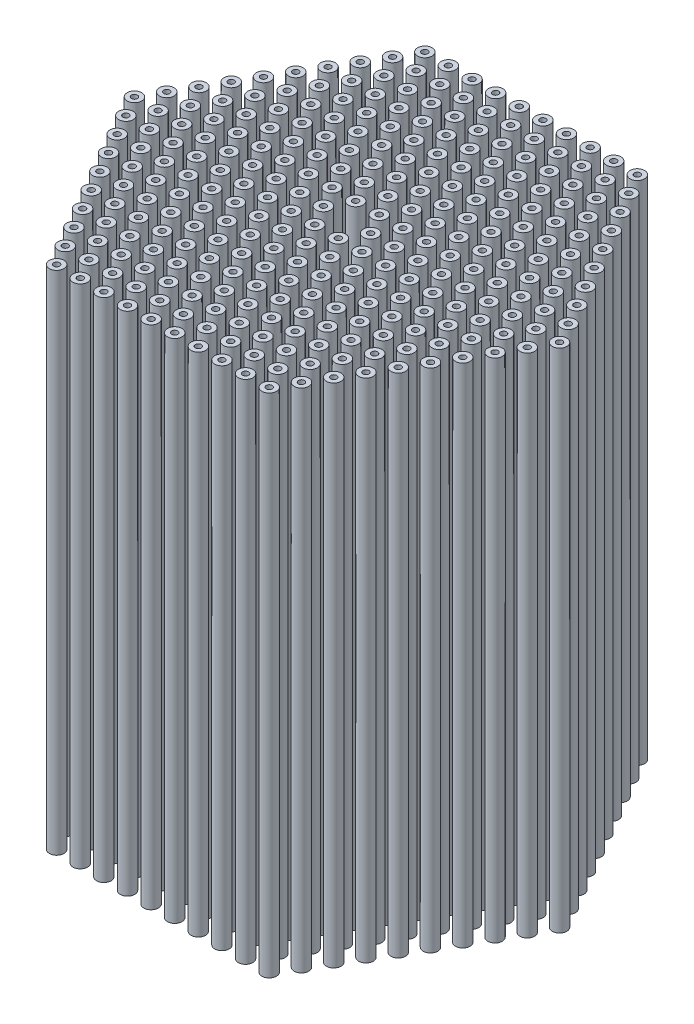
from build123d import *

# Parameters (mm, degrees)
ESBO_O1_R                = 15.35
ESBO_O1_R_2              = 6.35
RESSALTO_EXTRUS_O1_DEPTH = 1072.5


with BuildPart() as part:
    # Esboço1 → Ressalto-extrusão1 (new body)
    # profile 1 of 270: a face of its own
    with BuildSketch(Plane(origin=(0, 0, 0), x_dir=(1, 0, 0), z_dir=(0, 1, 0))):
        with Locations((-25, 43.301270189)):
            Circle(ESBO_O1_R)
        with Locations((-25, 43.301270189)):
            Circle(ESBO_O1_R_2, mode=Mode.SUBTRACT)
    # profile 2 of 270: a face of its own
    with BuildSketch(Plane(origin=(0, 0, 0), x_dir=(1, 0, 0), z_dir=(0, 1, 0))):
        with Locations((0, 86.602540378)):
            Circle(ESBO_O1_R)
        with Locations((0, 86.602540378)):
            Circle(ESBO_O1_R_2, mode=Mode.SUBTRACT)
    # profile 3 of 270: a face of its own
    with BuildSketch(Plane(origin=(0, 0, 0), x_dir=(1, 0, 0), z_dir=(0, 1, 0))):
        with Locations((-25, 129.903810568)):
            Circle(ESBO_O1_R)
        with Locations((-25, 129.903810568)):
            Circle(ESBO_O1_R_2, mode=Mode.SUBTRACT)
    # profile 4 of 270: a face of its own
    with BuildSketch(Plane(origin=(0, 0, 0), x_dir=(1, 0, 0), z_dir=(0, 1, 0))):
        with Locations((25, 129.903810568)):
            Circle(ESBO_O1_R)
        with Locations((25, 129.903810568)):
            Circle(ESBO_O1_R_2, mode=Mode.SUBTRACT)
    # profile 5 of 270: a face of its own
    with BuildSketch(Plane(origin=(0, 0, 0), x_dir=(1, 0, 0), z_dir=(0, 1, 0))):
        with Locations((0, 173.205080757)):
            Circle(ESBO_O1_R)
        with Locations((0, 173.205080757)):
            Circle(ESBO_O1_R_2, mode=Mode.SUBTRACT)
    # profile 6 of 270: a face of its own
    with BuildSketch(Plane(origin=(0, 0, 0), x_dir=(1, 0, 0), z_dir=(0, 1, 0))):
        with Locations((25, 43.301270189)):
            Circle(ESBO_O1_R)
        with Locations((25, 43.301270189)):
            Circle(ESBO_O1_R_2, mode=Mode.SUBTRACT)
    # profile 7 of 270: a face of its own
    with BuildSketch(Plane(origin=(0, 0, 0), x_dir=(1, 0, 0), z_dir=(0, 1, 0))):
        with Locations((-25, 216.506350946)):
            Circle(ESBO_O1_R)
        with Locations((-25, 216.506350946)):
            Circle(ESBO_O1_R_2, mode=Mode.SUBTRACT)
    # profile 8 of 270: a face of its own
    with BuildSketch(Plane(origin=(0, 0, 0), x_dir=(1, 0, 0), z_dir=(0, 1, 0))):
        with Locations((25, 216.506350946)):
            Circle(ESBO_O1_R)
        with Locations((25, 216.506350946)):
            Circle(ESBO_O1_R_2, mode=Mode.SUBTRACT)
    # profile 9 of 270: a face of its own
    with BuildSketch(Plane(origin=(0, 0, 0), x_dir=(1, 0, 0), z_dir=(0, 1, 0))):
        with Locations((0, 259.807621135)):
            Circle(ESBO_O1_R)
        with Locations((0, 259.807621135)):
            Circle(ESBO_O1_R_2, mode=Mode.SUBTRACT)
    # profile 10 of 270: a face of its own
    with BuildSketch(Plane(origin=(0, 0, 0), x_dir=(1, 0, 0), z_dir=(0, 1, 0))):
        with Locations((-25, 303.108891325)):
            Circle(ESBO_O1_R)
        with Locations((-25, 303.108891325)):
            Circle(ESBO_O1_R_2, mode=Mode.SUBTRACT)
    # profile 11 of 270: a face of its own
    with BuildSketch(Plane(origin=(0, 0, 0), x_dir=(1, 0, 0), z_dir=(0, 1, 0))):
        with Locations((25, 303.108891325)):
            Circle(ESBO_O1_R)
        with Locations((25, 303.108891325)):
            Circle(ESBO_O1_R_2, mode=Mode.SUBTRACT)
    # profile 12 of 270: a face of its own
    with BuildSketch(Plane(origin=(0, 0, 0), x_dir=(1, 0, 0), z_dir=(0, 1, 0))):
        with Locations((0, 346.410161514)):
            Circle(ESBO_O1_R)
        with Locations((0, 346.410161514)):
            Circle(ESBO_O1_R_2, mode=Mode.SUBTRACT)
    # profile 13 of 270: a face of its own
    with BuildSketch(Plane(origin=(0, 0, 0), x_dir=(1, 0, 0), z_dir=(0, 1, 0))):
        with Locations((-25, 389.711431703)):
            Circle(ESBO_O1_R)
        with Locations((-25, 389.711431703)):
            Circle(ESBO_O1_R_2, mode=Mode.SUBTRACT)
    # profile 14 of 270: a face of its own
    with BuildSketch(Plane(origin=(0, 0, 0), x_dir=(1, 0, 0), z_dir=(0, 1, 0))):
        with Locations((25, 389.711431703)):
            Circle(ESBO_O1_R)
        with Locations((25, 389.711431703)):
            Circle(ESBO_O1_R_2, mode=Mode.SUBTRACT)
    # profile 15 of 270: a face of its own
    with BuildSketch(Plane(origin=(0, 0, 0), x_dir=(1, 0, 0), z_dir=(0, 1, 0))):
        with Locations((50, 0)):
            Circle(ESBO_O1_R)
        with Locations((50, 0)):
            Circle(ESBO_O1_R_2, mode=Mode.SUBTRACT)
    # profile 16 of 270: a face of its own
    with BuildSketch(Plane(origin=(0, 0, 0), x_dir=(1, 0, 0), z_dir=(0, 1, 0))):
        with Locations((100, 0)):
            Circle(ESBO_O1_R)
        with Locations((100, 0)):
            Circle(ESBO_O1_R_2, mode=Mode.SUBTRACT)
    # profile 17 of 270: a face of its own
    with BuildSketch(Plane(origin=(0, 0, 0), x_dir=(1, 0, 0), z_dir=(0, 1, 0))):
        with Locations((150, 0)):
            Circle(ESBO_O1_R)
        with Locations((150, 0)):
            Circle(ESBO_O1_R_2, mode=Mode.SUBTRACT)
    # profile 18 of 270: a face of its own
    with BuildSketch(Plane(origin=(0, 0, 0), x_dir=(1, 0, 0), z_dir=(0, 1, 0))):
        with Locations((200, 0)):
            Circle(ESBO_O1_R)
        with Locations((200, 0)):
            Circle(ESBO_O1_R_2, mode=Mode.SUBTRACT)
    # profile 19 of 270: a face of its own
    with BuildSketch(Plane(origin=(0, 0, 0), x_dir=(1, 0, 0), z_dir=(0, 1, 0))):
        with Locations((250, 0)):
            Circle(ESBO_O1_R)
        with Locations((250, 0)):
            Circle(ESBO_O1_R_2, mode=Mode.SUBTRACT)
    # profile 20 of 270: a face of its own
    with BuildSketch(Plane(origin=(0, 0, 0), x_dir=(1, 0, 0), z_dir=(0, 1, 0))):
        with Locations((300, 0)):
            Circle(ESBO_O1_R)
        with Locations((300, 0)):
            Circle(ESBO_O1_R_2, mode=Mode.SUBTRACT)
    # profile 21 of 270: a face of its own
    with BuildSketch(Plane(origin=(0, 0, 0), x_dir=(1, 0, 0), z_dir=(0, 1, 0))):
        with Locations((350, 0)):
            Circle(ESBO_O1_R)
        with Locations((350, 0)):
            Circle(ESBO_O1_R_2, mode=Mode.SUBTRACT)
    # profile 22 of 270: a face of its own
    with BuildSketch(Plane(origin=(0, 0, 0), x_dir=(1, 0, 0), z_dir=(0, 1, 0))):
        with Locations((400, 0)):
            Circle(ESBO_O1_R)
        with Locations((400, 0)):
            Circle(ESBO_O1_R_2, mode=Mode.SUBTRACT)
    # profile 23 of 270: a face of its own
    with BuildSketch(Plane(origin=(0, 0, 0), x_dir=(1, 0, 0), z_dir=(0, 1, 0))):
        with Locations((450, 0)):
            Circle(ESBO_O1_R)
        with Locations((450, 0)):
            Circle(ESBO_O1_R_2, mode=Mode.SUBTRACT)
    # profile 24 of 270: a face of its own
    with BuildSketch(Plane(origin=(0, 0, 0), x_dir=(1, 0, 0), z_dir=(0, 1, 0))):
        with Locations((-50, 0)):
            Circle(ESBO_O1_R)
        with Locations((-50, 0)):
            Circle(ESBO_O1_R_2, mode=Mode.SUBTRACT)
    # profile 25 of 270: a face of its own
    with BuildSketch(Plane(origin=(0, 0, 0), x_dir=(1, 0, 0), z_dir=(0, 1, 0))):
        with Locations((-100, 0)):
            Circle(ESBO_O1_R)
        with Locations((-100, 0)):
            Circle(ESBO_O1_R_2, mode=Mode.SUBTRACT)
    # profile 26 of 270: a face of its own
    with BuildSketch(Plane(origin=(0, 0, 0), x_dir=(1, 0, 0), z_dir=(0, 1, 0))):
        with Locations((-150, 0)):
            Circle(ESBO_O1_R)
        with Locations((-150, 0)):
            Circle(ESBO_O1_R_2, mode=Mode.SUBTRACT)
    # profile 27 of 270: a face of its own
    with BuildSketch(Plane(origin=(0, 0, 0), x_dir=(1, 0, 0), z_dir=(0, 1, 0))):
        with Locations((-200, 0)):
            Circle(ESBO_O1_R)
        with Locations((-200, 0)):
            Circle(ESBO_O1_R_2, mode=Mode.SUBTRACT)
    # profile 28 of 270: a face of its own
    with BuildSketch(Plane(origin=(0, 0, 0), x_dir=(1, 0, 0), z_dir=(0, 1, 0))):
        with Locations((-250, 0)):
            Circle(ESBO_O1_R)
        with Locations((-250, 0)):
            Circle(ESBO_O1_R_2, mode=Mode.SUBTRACT)
    # profile 29 of 270: a face of its own
    with BuildSketch(Plane(origin=(0, 0, 0), x_dir=(1, 0, 0), z_dir=(0, 1, 0))):
        with Locations((-300, 0)):
            Circle(ESBO_O1_R)
        with Locations((-300, 0)):
            Circle(ESBO_O1_R_2, mode=Mode.SUBTRACT)
    # profile 30 of 270: a face of its own
    with BuildSketch(Plane(origin=(0, 0, 0), x_dir=(1, 0, 0), z_dir=(0, 1, 0))):
        with Locations((-350, 0)):
            Circle(ESBO_O1_R)
        with Locations((-350, 0)):
            Circle(ESBO_O1_R_2, mode=Mode.SUBTRACT)
    # profile 31 of 270: a face of its own
    with BuildSketch(Plane(origin=(0, 0, 0), x_dir=(1, 0, 0), z_dir=(0, 1, 0))):
        with Locations((-400, 0)):
            Circle(ESBO_O1_R)
        with Locations((-400, 0)):
            Circle(ESBO_O1_R_2, mode=Mode.SUBTRACT)
    # profile 32 of 270: a face of its own
    with BuildSketch(Plane(origin=(0, 0, 0), x_dir=(1, 0, 0), z_dir=(0, 1, 0))):
        with Locations((-450, 0)):
            Circle(ESBO_O1_R)
        with Locations((-450, 0)):
            Circle(ESBO_O1_R_2, mode=Mode.SUBTRACT)
    # profile 33 of 270: a face of its own
    with BuildSketch(Plane(origin=(0, 0, 0), x_dir=(1, 0, 0), z_dir=(0, 1, 0))):
        with Locations((75, 43.301270189)):
            Circle(ESBO_O1_R)
        with Locations((75, 43.301270189)):
            Circle(ESBO_O1_R_2, mode=Mode.SUBTRACT)
    # profile 34 of 270: a face of its own
    with BuildSketch(Plane(origin=(0, 0, 0), x_dir=(1, 0, 0), z_dir=(0, 1, 0))):
        with Locations((125, 43.301270189)):
            Circle(ESBO_O1_R)
        with Locations((125, 43.301270189)):
            Circle(ESBO_O1_R_2, mode=Mode.SUBTRACT)
    # profile 35 of 270: a face of its own
    with BuildSketch(Plane(origin=(0, 0, 0), x_dir=(1, 0, 0), z_dir=(0, 1, 0))):
        with Locations((175, 43.301270189)):
            Circle(ESBO_O1_R)
        with Locations((175, 43.301270189)):
            Circle(ESBO_O1_R_2, mode=Mode.SUBTRACT)
    # profile 36 of 270: a face of its own
    with BuildSketch(Plane(origin=(0, 0, 0), x_dir=(1, 0, 0), z_dir=(0, 1, 0))):
        with Locations((225, 43.301270189)):
            Circle(ESBO_O1_R)
        with Locations((225, 43.301270189)):
            Circle(ESBO_O1_R_2, mode=Mode.SUBTRACT)
    # profile 37 of 270: a face of its own
    with BuildSketch(Plane(origin=(0, 0, 0), x_dir=(1, 0, 0), z_dir=(0, 1, 0))):
        with Locations((275, 43.301270189)):
            Circle(ESBO_O1_R)
        with Locations((275, 43.301270189)):
            Circle(ESBO_O1_R_2, mode=Mode.SUBTRACT)
    # profile 38 of 270: a face of its own
    with BuildSketch(Plane(origin=(0, 0, 0), x_dir=(1, 0, 0), z_dir=(0, 1, 0))):
        with Locations((325, 43.301270189)):
            Circle(ESBO_O1_R)
        with Locations((325, 43.301270189)):
            Circle(ESBO_O1_R_2, mode=Mode.SUBTRACT)
    # profile 39 of 270: a face of its own
    with BuildSketch(Plane(origin=(0, 0, 0), x_dir=(1, 0, 0), z_dir=(0, 1, 0))):
        with Locations((375, 43.301270189)):
            Circle(ESBO_O1_R)
        with Locations((375, 43.301270189)):
            Circle(ESBO_O1_R_2, mode=Mode.SUBTRACT)
    # profile 40 of 270: a face of its own
    with BuildSketch(Plane(origin=(0, 0, 0), x_dir=(1, 0, 0), z_dir=(0, 1, 0))):
        with Locations((425, 43.301270189)):
            Circle(ESBO_O1_R)
        with Locations((425, 43.301270189)):
            Circle(ESBO_O1_R_2, mode=Mode.SUBTRACT)
    # profile 41 of 270: a face of its own
    with BuildSketch(Plane(origin=(0, 0, 0), x_dir=(1, 0, 0), z_dir=(0, 1, 0))):
        with Locations((50, 86.602540378)):
            Circle(ESBO_O1_R)
        with Locations((50, 86.602540378)):
            Circle(ESBO_O1_R_2, mode=Mode.SUBTRACT)
    # profile 42 of 270: a face of its own
    with BuildSketch(Plane(origin=(0, 0, 0), x_dir=(1, 0, 0), z_dir=(0, 1, 0))):
        with Locations((100, 86.602540378)):
            Circle(ESBO_O1_R)
        with Locations((100, 86.602540378)):
            Circle(ESBO_O1_R_2, mode=Mode.SUBTRACT)
    # profile 43 of 270: a face of its own
    with BuildSketch(Plane(origin=(0, 0, 0), x_dir=(1, 0, 0), z_dir=(0, 1, 0))):
        with Locations((150, 86.602540378)):
            Circle(ESBO_O1_R)
        with Locations((150, 86.602540378)):
            Circle(ESBO_O1_R_2, mode=Mode.SUBTRACT)
    # profile 44 of 270: a face of its own
    with BuildSketch(Plane(origin=(0, 0, 0), x_dir=(1, 0, 0), z_dir=(0, 1, 0))):
        with Locations((200, 86.602540378)):
            Circle(ESBO_O1_R)
        with Locations((200, 86.602540378)):
            Circle(ESBO_O1_R_2, mode=Mode.SUBTRACT)
    # profile 45 of 270: a face of its own
    with BuildSketch(Plane(origin=(0, 0, 0), x_dir=(1, 0, 0), z_dir=(0, 1, 0))):
        with Locations((250, 86.602540378)):
            Circle(ESBO_O1_R)
        with Locations((250, 86.602540378)):
            Circle(ESBO_O1_R_2, mode=Mode.SUBTRACT)
    # profile 46 of 270: a face of its own
    with BuildSketch(Plane(origin=(0, 0, 0), x_dir=(1, 0, 0), z_dir=(0, 1, 0))):
        with Locations((300, 86.602540378)):
            Circle(ESBO_O1_R)
        with Locations((300, 86.602540378)):
            Circle(ESBO_O1_R_2, mode=Mode.SUBTRACT)
    # profile 47 of 270: a face of its own
    with BuildSketch(Plane(origin=(0, 0, 0), x_dir=(1, 0, 0), z_dir=(0, 1, 0))):
        with Locations((350, 86.602540378)):
            Circle(ESBO_O1_R)
        with Locations((350, 86.602540378)):
            Circle(ESBO_O1_R_2, mode=Mode.SUBTRACT)
    # profile 48 of 270: a face of its own
    with BuildSketch(Plane(origin=(0, 0, 0), x_dir=(1, 0, 0), z_dir=(0, 1, 0))):
        with Locations((400, 86.602540378)):
            Circle(ESBO_O1_R)
        with Locations((400, 86.602540378)):
            Circle(ESBO_O1_R_2, mode=Mode.SUBTRACT)
    # profile 49 of 270: a face of its own
    with BuildSketch(Plane(origin=(0, 0, 0), x_dir=(1, 0, 0), z_dir=(0, 1, 0))):
        with Locations((75, 129.903810568)):
            Circle(ESBO_O1_R)
        with Locations((75, 129.903810568)):
            Circle(ESBO_O1_R_2, mode=Mode.SUBTRACT)
    # profile 50 of 270: a face of its own
    with BuildSketch(Plane(origin=(0, 0, 0), x_dir=(1, 0, 0), z_dir=(0, 1, 0))):
        with Locations((125, 129.903810568)):
            Circle(ESBO_O1_R)
        with Locations((125, 129.903810568)):
            Circle(ESBO_O1_R_2, mode=Mode.SUBTRACT)
    # profile 51 of 270: a face of its own
    with BuildSketch(Plane(origin=(0, 0, 0), x_dir=(1, 0, 0), z_dir=(0, 1, 0))):
        with Locations((175, 129.903810568)):
            Circle(ESBO_O1_R)
        with Locations((175, 129.903810568)):
            Circle(ESBO_O1_R_2, mode=Mode.SUBTRACT)
    # profile 52 of 270: a face of its own
    with BuildSketch(Plane(origin=(0, 0, 0), x_dir=(1, 0, 0), z_dir=(0, 1, 0))):
        with Locations((225, 129.903810568)):
            Circle(ESBO_O1_R)
        with Locations((225, 129.903810568)):
            Circle(ESBO_O1_R_2, mode=Mode.SUBTRACT)
    # profile 53 of 270: a face of its own
    with BuildSketch(Plane(origin=(0, 0, 0), x_dir=(1, 0, 0), z_dir=(0, 1, 0))):
        with Locations((275, 129.903810568)):
            Circle(ESBO_O1_R)
        with Locations((275, 129.903810568)):
            Circle(ESBO_O1_R_2, mode=Mode.SUBTRACT)
    # profile 54 of 270: a face of its own
    with BuildSketch(Plane(origin=(0, 0, 0), x_dir=(1, 0, 0), z_dir=(0, 1, 0))):
        with Locations((325, 129.903810568)):
            Circle(ESBO_O1_R)
        with Locations((325, 129.903810568)):
            Circle(ESBO_O1_R_2, mode=Mode.SUBTRACT)
    # profile 55 of 270: a face of its own
    with BuildSketch(Plane(origin=(0, 0, 0), x_dir=(1, 0, 0), z_dir=(0, 1, 0))):
        with Locations((375, 129.903810568)):
            Circle(ESBO_O1_R)
        with Locations((375, 129.903810568)):
            Circle(ESBO_O1_R_2, mode=Mode.SUBTRACT)
    # profile 56 of 270: a face of its own
    with BuildSketch(Plane(origin=(0, 0, 0), x_dir=(1, 0, 0), z_dir=(0, 1, 0))):
        with Locations((50, 173.205080757)):
            Circle(ESBO_O1_R)
        with Locations((50, 173.205080757)):
            Circle(ESBO_O1_R_2, mode=Mode.SUBTRACT)
    # profile 57 of 270: a face of its own
    with BuildSketch(Plane(origin=(0, 0, 0), x_dir=(1, 0, 0), z_dir=(0, 1, 0))):
        with Locations((100, 173.205080757)):
            Circle(ESBO_O1_R)
        with Locations((100, 173.205080757)):
            Circle(ESBO_O1_R_2, mode=Mode.SUBTRACT)
    # profile 58 of 270: a face of its own
    with BuildSketch(Plane(origin=(0, 0, 0), x_dir=(1, 0, 0), z_dir=(0, 1, 0))):
        with Locations((150, 173.205080757)):
            Circle(ESBO_O1_R)
        with Locations((150, 173.205080757)):
            Circle(ESBO_O1_R_2, mode=Mode.SUBTRACT)
    # profile 59 of 270: a face of its own
    with BuildSketch(Plane(origin=(0, 0, 0), x_dir=(1, 0, 0), z_dir=(0, 1, 0))):
        with Locations((200, 173.205080757)):
            Circle(ESBO_O1_R)
        with Locations((200, 173.205080757)):
            Circle(ESBO_O1_R_2, mode=Mode.SUBTRACT)
    # profile 60 of 270: a face of its own
    with BuildSketch(Plane(origin=(0, 0, 0), x_dir=(1, 0, 0), z_dir=(0, 1, 0))):
        with Locations((250, 173.205080757)):
            Circle(ESBO_O1_R)
        with Locations((250, 173.205080757)):
            Circle(ESBO_O1_R_2, mode=Mode.SUBTRACT)
    # profile 61 of 270: a face of its own
    with BuildSketch(Plane(origin=(0, 0, 0), x_dir=(1, 0, 0), z_dir=(0, 1, 0))):
        with Locations((300, 173.205080757)):
            Circle(ESBO_O1_R)
        with Locations((300, 173.205080757)):
            Circle(ESBO_O1_R_2, mode=Mode.SUBTRACT)
    # profile 62 of 270: a face of its own
    with BuildSketch(Plane(origin=(0, 0, 0), x_dir=(1, 0, 0), z_dir=(0, 1, 0))):
        with Locations((350, 173.205080757)):
            Circle(ESBO_O1_R)
        with Locations((350, 173.205080757)):
            Circle(ESBO_O1_R_2, mode=Mode.SUBTRACT)
    # profile 63 of 270: a face of its own
    with BuildSketch(Plane(origin=(0, 0, 0), x_dir=(1, 0, 0), z_dir=(0, 1, 0))):
        with Locations((75, 216.506350946)):
            Circle(ESBO_O1_R)
        with Locations((75, 216.506350946)):
            Circle(ESBO_O1_R_2, mode=Mode.SUBTRACT)
    # profile 64 of 270: a face of its own
    with BuildSketch(Plane(origin=(0, 0, 0), x_dir=(1, 0, 0), z_dir=(0, 1, 0))):
        with Locations((125, 216.506350946)):
            Circle(ESBO_O1_R)
        with Locations((125, 216.506350946)):
            Circle(ESBO_O1_R_2, mode=Mode.SUBTRACT)
    # profile 65 of 270: a face of its own
    with BuildSketch(Plane(origin=(0, 0, 0), x_dir=(1, 0, 0), z_dir=(0, 1, 0))):
        with Locations((175, 216.506350946)):
            Circle(ESBO_O1_R)
        with Locations((175, 216.506350946)):
            Circle(ESBO_O1_R_2, mode=Mode.SUBTRACT)
    # profile 66 of 270: a face of its own
    with BuildSketch(Plane(origin=(0, 0, 0), x_dir=(1, 0, 0), z_dir=(0, 1, 0))):
        with Locations((225, 216.506350946)):
            Circle(ESBO_O1_R)
        with Locations((225, 216.506350946)):
            Circle(ESBO_O1_R_2, mode=Mode.SUBTRACT)
    # profile 67 of 270: a face of its own
    with BuildSketch(Plane(origin=(0, 0, 0), x_dir=(1, 0, 0), z_dir=(0, 1, 0))):
        with Locations((275, 216.506350946)):
            Circle(ESBO_O1_R)
        with Locations((275, 216.506350946)):
            Circle(ESBO_O1_R_2, mode=Mode.SUBTRACT)
    # profile 68 of 270: a face of its own
    with BuildSketch(Plane(origin=(0, 0, 0), x_dir=(1, 0, 0), z_dir=(0, 1, 0))):
        with Locations((325, 216.506350946)):
            Circle(ESBO_O1_R)
        with Locations((325, 216.506350946)):
            Circle(ESBO_O1_R_2, mode=Mode.SUBTRACT)
    # profile 69 of 270: a face of its own
    with BuildSketch(Plane(origin=(0, 0, 0), x_dir=(1, 0, 0), z_dir=(0, 1, 0))):
        with Locations((50, 259.807621135)):
            Circle(ESBO_O1_R)
        with Locations((50, 259.807621135)):
            Circle(ESBO_O1_R_2, mode=Mode.SUBTRACT)
    # profile 70 of 270: a face of its own
    with BuildSketch(Plane(origin=(0, 0, 0), x_dir=(1, 0, 0), z_dir=(0, 1, 0))):
        with Locations((100, 259.807621135)):
            Circle(ESBO_O1_R)
        with Locations((100, 259.807621135)):
            Circle(ESBO_O1_R_2, mode=Mode.SUBTRACT)
    # profile 71 of 270: a face of its own
    with BuildSketch(Plane(origin=(0, 0, 0), x_dir=(1, 0, 0), z_dir=(0, 1, 0))):
        with Locations((150, 259.807621135)):
            Circle(ESBO_O1_R)
        with Locations((150, 259.807621135)):
            Circle(ESBO_O1_R_2, mode=Mode.SUBTRACT)
    # profile 72 of 270: a face of its own
    with BuildSketch(Plane(origin=(0, 0, 0), x_dir=(1, 0, 0), z_dir=(0, 1, 0))):
        with Locations((200, 259.807621135)):
            Circle(ESBO_O1_R)
        with Locations((200, 259.807621135)):
            Circle(ESBO_O1_R_2, mode=Mode.SUBTRACT)
    # profile 73 of 270: a face of its own
    with BuildSketch(Plane(origin=(0, 0, 0), x_dir=(1, 0, 0), z_dir=(0, 1, 0))):
        with Locations((250, 259.807621135)):
            Circle(ESBO_O1_R)
        with Locations((250, 259.807621135)):
            Circle(ESBO_O1_R_2, mode=Mode.SUBTRACT)
    # profile 74 of 270: a face of its own
    with BuildSketch(Plane(origin=(0, 0, 0), x_dir=(1, 0, 0), z_dir=(0, 1, 0))):
        with Locations((300, 259.807621135)):
            Circle(ESBO_O1_R)
        with Locations((300, 259.807621135)):
            Circle(ESBO_O1_R_2, mode=Mode.SUBTRACT)
    # profile 75 of 270: a face of its own
    with BuildSketch(Plane(origin=(0, 0, 0), x_dir=(1, 0, 0), z_dir=(0, 1, 0))):
        with Locations((75, 303.108891325)):
            Circle(ESBO_O1_R)
        with Locations((75, 303.108891325)):
            Circle(ESBO_O1_R_2, mode=Mode.SUBTRACT)
    # profile 76 of 270: a face of its own
    with BuildSketch(Plane(origin=(0, 0, 0), x_dir=(1, 0, 0), z_dir=(0, 1, 0))):
        with Locations((125, 303.108891325)):
            Circle(ESBO_O1_R)
        with Locations((125, 303.108891325)):
            Circle(ESBO_O1_R_2, mode=Mode.SUBTRACT)
    # profile 77 of 270: a face of its own
    with BuildSketch(Plane(origin=(0, 0, 0), x_dir=(1, 0, 0), z_dir=(0, 1, 0))):
        with Locations((175, 303.108891325)):
            Circle(ESBO_O1_R)
        with Locations((175, 303.108891325)):
            Circle(ESBO_O1_R_2, mode=Mode.SUBTRACT)
    # profile 78 of 270: a face of its own
    with BuildSketch(Plane(origin=(0, 0, 0), x_dir=(1, 0, 0), z_dir=(0, 1, 0))):
        with Locations((225, 303.108891325)):
            Circle(ESBO_O1_R)
        with Locations((225, 303.108891325)):
            Circle(ESBO_O1_R_2, mode=Mode.SUBTRACT)
    # profile 79 of 270: a face of its own
    with BuildSketch(Plane(origin=(0, 0, 0), x_dir=(1, 0, 0), z_dir=(0, 1, 0))):
        with Locations((275, 303.108891325)):
            Circle(ESBO_O1_R)
        with Locations((275, 303.108891325)):
            Circle(ESBO_O1_R_2, mode=Mode.SUBTRACT)
    # profile 80 of 270: a face of its own
    with BuildSketch(Plane(origin=(0, 0, 0), x_dir=(1, 0, 0), z_dir=(0, 1, 0))):
        with Locations((50, 346.410161514)):
            Circle(ESBO_O1_R)
        with Locations((50, 346.410161514)):
            Circle(ESBO_O1_R_2, mode=Mode.SUBTRACT)
    # profile 81 of 270: a face of its own
    with BuildSketch(Plane(origin=(0, 0, 0), x_dir=(1, 0, 0), z_dir=(0, 1, 0))):
        with Locations((100, 346.410161514)):
            Circle(ESBO_O1_R)
        with Locations((100, 346.410161514)):
            Circle(ESBO_O1_R_2, mode=Mode.SUBTRACT)
    # profile 82 of 270: a face of its own
    with BuildSketch(Plane(origin=(0, 0, 0), x_dir=(1, 0, 0), z_dir=(0, 1, 0))):
        with Locations((150, 346.410161514)):
            Circle(ESBO_O1_R)
        with Locations((150, 346.410161514)):
            Circle(ESBO_O1_R_2, mode=Mode.SUBTRACT)
    # profile 83 of 270: a face of its own
    with BuildSketch(Plane(origin=(0, 0, 0), x_dir=(1, 0, 0), z_dir=(0, 1, 0))):
        with Locations((200, 346.410161514)):
            Circle(ESBO_O1_R)
        with Locations((200, 346.410161514)):
            Circle(ESBO_O1_R_2, mode=Mode.SUBTRACT)
    # profile 84 of 270: a face of its own
    with BuildSketch(Plane(origin=(0, 0, 0), x_dir=(1, 0, 0), z_dir=(0, 1, 0))):
        with Locations((250, 346.410161514)):
            Circle(ESBO_O1_R)
        with Locations((250, 346.410161514)):
            Circle(ESBO_O1_R_2, mode=Mode.SUBTRACT)
    # profile 85 of 270: a face of its own
    with BuildSketch(Plane(origin=(0, 0, 0), x_dir=(1, 0, 0), z_dir=(0, 1, 0))):
        with Locations((75, 389.711431703)):
            Circle(ESBO_O1_R)
        with Locations((75, 389.711431703)):
            Circle(ESBO_O1_R_2, mode=Mode.SUBTRACT)
    # profile 86 of 270: a face of its own
    with BuildSketch(Plane(origin=(0, 0, 0), x_dir=(1, 0, 0), z_dir=(0, 1, 0))):
        with Locations((125, 389.711431703)):
            Circle(ESBO_O1_R)
        with Locations((125, 389.711431703)):
            Circle(ESBO_O1_R_2, mode=Mode.SUBTRACT)
    # profile 87 of 270: a face of its own
    with BuildSketch(Plane(origin=(0, 0, 0), x_dir=(1, 0, 0), z_dir=(0, 1, 0))):
        with Locations((175, 389.711431703)):
            Circle(ESBO_O1_R)
        with Locations((175, 389.711431703)):
            Circle(ESBO_O1_R_2, mode=Mode.SUBTRACT)
    # profile 88 of 270: a face of its own
    with BuildSketch(Plane(origin=(0, 0, 0), x_dir=(1, 0, 0), z_dir=(0, 1, 0))):
        with Locations((225, 389.711431703)):
            Circle(ESBO_O1_R)
        with Locations((225, 389.711431703)):
            Circle(ESBO_O1_R_2, mode=Mode.SUBTRACT)
    # profile 89 of 270: a face of its own
    with BuildSketch(Plane(origin=(0, 0, 0), x_dir=(1, 0, 0), z_dir=(0, 1, 0))):
        with Locations((-225, 389.711431703)):
            Circle(ESBO_O1_R)
        with Locations((-225, 389.711431703)):
            Circle(ESBO_O1_R_2, mode=Mode.SUBTRACT)
    # profile 90 of 270: a face of its own
    with BuildSketch(Plane(origin=(0, 0, 0), x_dir=(1, 0, 0), z_dir=(0, 1, 0))):
        with Locations((-175, 389.711431703)):
            Circle(ESBO_O1_R)
        with Locations((-175, 389.711431703)):
            Circle(ESBO_O1_R_2, mode=Mode.SUBTRACT)
    # profile 91 of 270: a face of its own
    with BuildSketch(Plane(origin=(0, 0, 0), x_dir=(1, 0, 0), z_dir=(0, 1, 0))):
        with Locations((-125, 389.711431703)):
            Circle(ESBO_O1_R)
        with Locations((-125, 389.711431703)):
            Circle(ESBO_O1_R_2, mode=Mode.SUBTRACT)
    # profile 92 of 270: a face of its own
    with BuildSketch(Plane(origin=(0, 0, 0), x_dir=(1, 0, 0), z_dir=(0, 1, 0))):
        with Locations((-75, 389.711431703)):
            Circle(ESBO_O1_R)
        with Locations((-75, 389.711431703)):
            Circle(ESBO_O1_R_2, mode=Mode.SUBTRACT)
    # profile 93 of 270: a face of its own
    with BuildSketch(Plane(origin=(0, 0, 0), x_dir=(1, 0, 0), z_dir=(0, 1, 0))):
        with Locations((-250, 346.410161514)):
            Circle(ESBO_O1_R)
        with Locations((-250, 346.410161514)):
            Circle(ESBO_O1_R_2, mode=Mode.SUBTRACT)
    # profile 94 of 270: a face of its own
    with BuildSketch(Plane(origin=(0, 0, 0), x_dir=(1, 0, 0), z_dir=(0, 1, 0))):
        with Locations((-200, 346.410161514)):
            Circle(ESBO_O1_R)
        with Locations((-200, 346.410161514)):
            Circle(ESBO_O1_R_2, mode=Mode.SUBTRACT)
    # profile 95 of 270: a face of its own
    with BuildSketch(Plane(origin=(0, 0, 0), x_dir=(1, 0, 0), z_dir=(0, 1, 0))):
        with Locations((-150, 346.410161514)):
            Circle(ESBO_O1_R)
        with Locations((-150, 346.410161514)):
            Circle(ESBO_O1_R_2, mode=Mode.SUBTRACT)
    # profile 96 of 270: a face of its own
    with BuildSketch(Plane(origin=(0, 0, 0), x_dir=(1, 0, 0), z_dir=(0, 1, 0))):
        with Locations((-100, 346.410161514)):
            Circle(ESBO_O1_R)
        with Locations((-100, 346.410161514)):
            Circle(ESBO_O1_R_2, mode=Mode.SUBTRACT)
    # profile 97 of 270: a face of its own
    with BuildSketch(Plane(origin=(0, 0, 0), x_dir=(1, 0, 0), z_dir=(0, 1, 0))):
        with Locations((-50, 346.410161514)):
            Circle(ESBO_O1_R)
        with Locations((-50, 346.410161514)):
            Circle(ESBO_O1_R_2, mode=Mode.SUBTRACT)
    # profile 98 of 270: a face of its own
    with BuildSketch(Plane(origin=(0, 0, 0), x_dir=(1, 0, 0), z_dir=(0, 1, 0))):
        with Locations((-275, 303.108891325)):
            Circle(ESBO_O1_R)
        with Locations((-275, 303.108891325)):
            Circle(ESBO_O1_R_2, mode=Mode.SUBTRACT)
    # profile 99 of 270: a face of its own
    with BuildSketch(Plane(origin=(0, 0, 0), x_dir=(1, 0, 0), z_dir=(0, 1, 0))):
        with Locations((-225, 303.108891325)):
            Circle(ESBO_O1_R)
        with Locations((-225, 303.108891325)):
            Circle(ESBO_O1_R_2, mode=Mode.SUBTRACT)
    # profile 100 of 270: a face of its own
    with BuildSketch(Plane(origin=(0, 0, 0), x_dir=(1, 0, 0), z_dir=(0, 1, 0))):
        with Locations((-175, 303.108891325)):
            Circle(ESBO_O1_R)
        with Locations((-175, 303.108891325)):
            Circle(ESBO_O1_R_2, mode=Mode.SUBTRACT)
    # profile 101 of 270: a face of its own
    with BuildSketch(Plane(origin=(0, 0, 0), x_dir=(1, 0, 0), z_dir=(0, 1, 0))):
        with Locations((-125, 303.108891325)):
            Circle(ESBO_O1_R)
        with Locations((-125, 303.108891325)):
            Circle(ESBO_O1_R_2, mode=Mode.SUBTRACT)
    # profile 102 of 270: a face of its own
    with BuildSketch(Plane(origin=(0, 0, 0), x_dir=(1, 0, 0), z_dir=(0, 1, 0))):
        with Locations((-75, 303.108891325)):
            Circle(ESBO_O1_R)
        with Locations((-75, 303.108891325)):
            Circle(ESBO_O1_R_2, mode=Mode.SUBTRACT)
    # profile 103 of 270: a face of its own
    with BuildSketch(Plane(origin=(0, 0, 0), x_dir=(1, 0, 0), z_dir=(0, 1, 0))):
        with Locations((-300, 259.807621135)):
            Circle(ESBO_O1_R)
        with Locations((-300, 259.807621135)):
            Circle(ESBO_O1_R_2, mode=Mode.SUBTRACT)
    # profile 104 of 270: a face of its own
    with BuildSketch(Plane(origin=(0, 0, 0), x_dir=(1, 0, 0), z_dir=(0, 1, 0))):
        with Locations((-250, 259.807621135)):
            Circle(ESBO_O1_R)
        with Locations((-250, 259.807621135)):
            Circle(ESBO_O1_R_2, mode=Mode.SUBTRACT)
    # profile 105 of 270: a face of its own
    with BuildSketch(Plane(origin=(0, 0, 0), x_dir=(1, 0, 0), z_dir=(0, 1, 0))):
        with Locations((-200, 259.807621135)):
            Circle(ESBO_O1_R)
        with Locations((-200, 259.807621135)):
            Circle(ESBO_O1_R_2, mode=Mode.SUBTRACT)
    # profile 106 of 270: a face of its own
    with BuildSketch(Plane(origin=(0, 0, 0), x_dir=(1, 0, 0), z_dir=(0, 1, 0))):
        with Locations((-150, 259.807621135)):
            Circle(ESBO_O1_R)
        with Locations((-150, 259.807621135)):
            Circle(ESBO_O1_R_2, mode=Mode.SUBTRACT)
    # profile 107 of 270: a face of its own
    with BuildSketch(Plane(origin=(0, 0, 0), x_dir=(1, 0, 0), z_dir=(0, 1, 0))):
        with Locations((-100, 259.807621135)):
            Circle(ESBO_O1_R)
        with Locations((-100, 259.807621135)):
            Circle(ESBO_O1_R_2, mode=Mode.SUBTRACT)
    # profile 108 of 270: a face of its own
    with BuildSketch(Plane(origin=(0, 0, 0), x_dir=(1, 0, 0), z_dir=(0, 1, 0))):
        with Locations((-50, 259.807621135)):
            Circle(ESBO_O1_R)
        with Locations((-50, 259.807621135)):
            Circle(ESBO_O1_R_2, mode=Mode.SUBTRACT)
    # profile 109 of 270: a face of its own
    with BuildSketch(Plane(origin=(0, 0, 0), x_dir=(1, 0, 0), z_dir=(0, 1, 0))):
        with Locations((-325, 216.506350946)):
            Circle(ESBO_O1_R)
        with Locations((-325, 216.506350946)):
            Circle(ESBO_O1_R_2, mode=Mode.SUBTRACT)
    # profile 110 of 270: a face of its own
    with BuildSketch(Plane(origin=(0, 0, 0), x_dir=(1, 0, 0), z_dir=(0, 1, 0))):
        with Locations((-275, 216.506350946)):
            Circle(ESBO_O1_R)
        with Locations((-275, 216.506350946)):
            Circle(ESBO_O1_R_2, mode=Mode.SUBTRACT)
    # profile 111 of 270: a face of its own
    with BuildSketch(Plane(origin=(0, 0, 0), x_dir=(1, 0, 0), z_dir=(0, 1, 0))):
        with Locations((-225, 216.506350946)):
            Circle(ESBO_O1_R)
        with Locations((-225, 216.506350946)):
            Circle(ESBO_O1_R_2, mode=Mode.SUBTRACT)
    # profile 112 of 270: a face of its own
    with BuildSketch(Plane(origin=(0, 0, 0), x_dir=(1, 0, 0), z_dir=(0, 1, 0))):
        with Locations((-175, 216.506350946)):
            Circle(ESBO_O1_R)
        with Locations((-175, 216.506350946)):
            Circle(ESBO_O1_R_2, mode=Mode.SUBTRACT)
    # profile 113 of 270: a face of its own
    with BuildSketch(Plane(origin=(0, 0, 0), x_dir=(1, 0, 0), z_dir=(0, 1, 0))):
        with Locations((-125, 216.506350946)):
            Circle(ESBO_O1_R)
        with Locations((-125, 216.506350946)):
            Circle(ESBO_O1_R_2, mode=Mode.SUBTRACT)
    # profile 114 of 270: a face of its own
    with BuildSketch(Plane(origin=(0, 0, 0), x_dir=(1, 0, 0), z_dir=(0, 1, 0))):
        with Locations((-75, 216.506350946)):
            Circle(ESBO_O1_R)
        with Locations((-75, 216.506350946)):
            Circle(ESBO_O1_R_2, mode=Mode.SUBTRACT)
    # profile 115 of 270: a face of its own
    with BuildSketch(Plane(origin=(0, 0, 0), x_dir=(1, 0, 0), z_dir=(0, 1, 0))):
        with Locations((-350, 173.205080757)):
            Circle(ESBO_O1_R)
        with Locations((-350, 173.205080757)):
            Circle(ESBO_O1_R_2, mode=Mode.SUBTRACT)
    # profile 116 of 270: a face of its own
    with BuildSketch(Plane(origin=(0, 0, 0), x_dir=(1, 0, 0), z_dir=(0, 1, 0))):
        with Locations((-300, 173.205080757)):
            Circle(ESBO_O1_R)
        with Locations((-300, 173.205080757)):
            Circle(ESBO_O1_R_2, mode=Mode.SUBTRACT)
    # profile 117 of 270: a face of its own
    with BuildSketch(Plane(origin=(0, 0, 0), x_dir=(1, 0, 0), z_dir=(0, 1, 0))):
        with Locations((-250, 173.205080757)):
            Circle(ESBO_O1_R)
        with Locations((-250, 173.205080757)):
            Circle(ESBO_O1_R_2, mode=Mode.SUBTRACT)
    # profile 118 of 270: a face of its own
    with BuildSketch(Plane(origin=(0, 0, 0), x_dir=(1, 0, 0), z_dir=(0, 1, 0))):
        with Locations((-200, 173.205080757)):
            Circle(ESBO_O1_R)
        with Locations((-200, 173.205080757)):
            Circle(ESBO_O1_R_2, mode=Mode.SUBTRACT)
    # profile 119 of 270: a face of its own
    with BuildSketch(Plane(origin=(0, 0, 0), x_dir=(1, 0, 0), z_dir=(0, 1, 0))):
        with Locations((-150, 173.205080757)):
            Circle(ESBO_O1_R)
        with Locations((-150, 173.205080757)):
            Circle(ESBO_O1_R_2, mode=Mode.SUBTRACT)
    # profile 120 of 270: a face of its own
    with BuildSketch(Plane(origin=(0, 0, 0), x_dir=(1, 0, 0), z_dir=(0, 1, 0))):
        with Locations((-100, 173.205080757)):
            Circle(ESBO_O1_R)
        with Locations((-100, 173.205080757)):
            Circle(ESBO_O1_R_2, mode=Mode.SUBTRACT)
    # profile 121 of 270: a face of its own
    with BuildSketch(Plane(origin=(0, 0, 0), x_dir=(1, 0, 0), z_dir=(0, 1, 0))):
        with Locations((-50, 173.205080757)):
            Circle(ESBO_O1_R)
        with Locations((-50, 173.205080757)):
            Circle(ESBO_O1_R_2, mode=Mode.SUBTRACT)
    # profile 122 of 270: a face of its own
    with BuildSketch(Plane(origin=(0, 0, 0), x_dir=(1, 0, 0), z_dir=(0, 1, 0))):
        with Locations((-375, 129.903810568)):
            Circle(ESBO_O1_R)
        with Locations((-375, 129.903810568)):
            Circle(ESBO_O1_R_2, mode=Mode.SUBTRACT)
    # profile 123 of 270: a face of its own
    with BuildSketch(Plane(origin=(0, 0, 0), x_dir=(1, 0, 0), z_dir=(0, 1, 0))):
        with Locations((-325, 129.903810568)):
            Circle(ESBO_O1_R)
        with Locations((-325, 129.903810568)):
            Circle(ESBO_O1_R_2, mode=Mode.SUBTRACT)
    # profile 124 of 270: a face of its own
    with BuildSketch(Plane(origin=(0, 0, 0), x_dir=(1, 0, 0), z_dir=(0, 1, 0))):
        with Locations((-275, 129.903810568)):
            Circle(ESBO_O1_R)
        with Locations((-275, 129.903810568)):
            Circle(ESBO_O1_R_2, mode=Mode.SUBTRACT)
    # profile 125 of 270: a face of its own
    with BuildSketch(Plane(origin=(0, 0, 0), x_dir=(1, 0, 0), z_dir=(0, 1, 0))):
        with Locations((-225, 129.903810568)):
            Circle(ESBO_O1_R)
        with Locations((-225, 129.903810568)):
            Circle(ESBO_O1_R_2, mode=Mode.SUBTRACT)
    # profile 126 of 270: a face of its own
    with BuildSketch(Plane(origin=(0, 0, 0), x_dir=(1, 0, 0), z_dir=(0, 1, 0))):
        with Locations((-175, 129.903810568)):
            Circle(ESBO_O1_R)
        with Locations((-175, 129.903810568)):
            Circle(ESBO_O1_R_2, mode=Mode.SUBTRACT)
    # profile 127 of 270: a face of its own
    with BuildSketch(Plane(origin=(0, 0, 0), x_dir=(1, 0, 0), z_dir=(0, 1, 0))):
        with Locations((-125, 129.903810568)):
            Circle(ESBO_O1_R)
        with Locations((-125, 129.903810568)):
            Circle(ESBO_O1_R_2, mode=Mode.SUBTRACT)
    # profile 128 of 270: a face of its own
    with BuildSketch(Plane(origin=(0, 0, 0), x_dir=(1, 0, 0), z_dir=(0, 1, 0))):
        with Locations((-75, 129.903810568)):
            Circle(ESBO_O1_R)
        with Locations((-75, 129.903810568)):
            Circle(ESBO_O1_R_2, mode=Mode.SUBTRACT)
    # profile 129 of 270: a face of its own
    with BuildSketch(Plane(origin=(0, 0, 0), x_dir=(1, 0, 0), z_dir=(0, 1, 0))):
        with Locations((-400, 86.602540378)):
            Circle(ESBO_O1_R)
        with Locations((-400, 86.602540378)):
            Circle(ESBO_O1_R_2, mode=Mode.SUBTRACT)
    # profile 130 of 270: a face of its own
    with BuildSketch(Plane(origin=(0, 0, 0), x_dir=(1, 0, 0), z_dir=(0, 1, 0))):
        with Locations((-350, 86.602540378)):
            Circle(ESBO_O1_R)
        with Locations((-350, 86.602540378)):
            Circle(ESBO_O1_R_2, mode=Mode.SUBTRACT)
    # profile 131 of 270: a face of its own
    with BuildSketch(Plane(origin=(0, 0, 0), x_dir=(1, 0, 0), z_dir=(0, 1, 0))):
        with Locations((-300, 86.602540378)):
            Circle(ESBO_O1_R)
        with Locations((-300, 86.602540378)):
            Circle(ESBO_O1_R_2, mode=Mode.SUBTRACT)
    # profile 132 of 270: a face of its own
    with BuildSketch(Plane(origin=(0, 0, 0), x_dir=(1, 0, 0), z_dir=(0, 1, 0))):
        with Locations((-250, 86.602540378)):
            Circle(ESBO_O1_R)
        with Locations((-250, 86.602540378)):
            Circle(ESBO_O1_R_2, mode=Mode.SUBTRACT)
    # profile 133 of 270: a face of its own
    with BuildSketch(Plane(origin=(0, 0, 0), x_dir=(1, 0, 0), z_dir=(0, 1, 0))):
        with Locations((-200, 86.602540378)):
            Circle(ESBO_O1_R)
        with Locations((-200, 86.602540378)):
            Circle(ESBO_O1_R_2, mode=Mode.SUBTRACT)
    # profile 134 of 270: a face of its own
    with BuildSketch(Plane(origin=(0, 0, 0), x_dir=(1, 0, 0), z_dir=(0, 1, 0))):
        with Locations((-150, 86.602540378)):
            Circle(ESBO_O1_R)
        with Locations((-150, 86.602540378)):
            Circle(ESBO_O1_R_2, mode=Mode.SUBTRACT)
    # profile 135 of 270: a face of its own
    with BuildSketch(Plane(origin=(0, 0, 0), x_dir=(1, 0, 0), z_dir=(0, 1, 0))):
        with Locations((-100, 86.602540378)):
            Circle(ESBO_O1_R)
        with Locations((-100, 86.602540378)):
            Circle(ESBO_O1_R_2, mode=Mode.SUBTRACT)
    # profile 136 of 270: a face of its own
    with BuildSketch(Plane(origin=(0, 0, 0), x_dir=(1, 0, 0), z_dir=(0, 1, 0))):
        with Locations((-50, 86.602540378)):
            Circle(ESBO_O1_R)
        with Locations((-50, 86.602540378)):
            Circle(ESBO_O1_R_2, mode=Mode.SUBTRACT)
    # profile 137 of 270: a face of its own
    with BuildSketch(Plane(origin=(0, 0, 0), x_dir=(1, 0, 0), z_dir=(0, 1, 0))):
        with Locations((-425, 43.301270189)):
            Circle(ESBO_O1_R)
        with Locations((-425, 43.301270189)):
            Circle(ESBO_O1_R_2, mode=Mode.SUBTRACT)
    # profile 138 of 270: a face of its own
    with BuildSketch(Plane(origin=(0, 0, 0), x_dir=(1, 0, 0), z_dir=(0, 1, 0))):
        with Locations((-375, 43.301270189)):
            Circle(ESBO_O1_R)
        with Locations((-375, 43.301270189)):
            Circle(ESBO_O1_R_2, mode=Mode.SUBTRACT)
    # profile 139 of 270: a face of its own
    with BuildSketch(Plane(origin=(0, 0, 0), x_dir=(1, 0, 0), z_dir=(0, 1, 0))):
        with Locations((-325, 43.301270189)):
            Circle(ESBO_O1_R)
        with Locations((-325, 43.301270189)):
            Circle(ESBO_O1_R_2, mode=Mode.SUBTRACT)
    # profile 140 of 270: a face of its own
    with BuildSketch(Plane(origin=(0, 0, 0), x_dir=(1, 0, 0), z_dir=(0, 1, 0))):
        with Locations((-275, 43.301270189)):
            Circle(ESBO_O1_R)
        with Locations((-275, 43.301270189)):
            Circle(ESBO_O1_R_2, mode=Mode.SUBTRACT)
    # profile 141 of 270: a face of its own
    with BuildSketch(Plane(origin=(0, 0, 0), x_dir=(1, 0, 0), z_dir=(0, 1, 0))):
        with Locations((-225, 43.301270189)):
            Circle(ESBO_O1_R)
        with Locations((-225, 43.301270189)):
            Circle(ESBO_O1_R_2, mode=Mode.SUBTRACT)
    # profile 142 of 270: a face of its own
    with BuildSketch(Plane(origin=(0, 0, 0), x_dir=(1, 0, 0), z_dir=(0, 1, 0))):
        with Locations((-175, 43.301270189)):
            Circle(ESBO_O1_R)
        with Locations((-175, 43.301270189)):
            Circle(ESBO_O1_R_2, mode=Mode.SUBTRACT)
    # profile 143 of 270: a face of its own
    with BuildSketch(Plane(origin=(0, 0, 0), x_dir=(1, 0, 0), z_dir=(0, 1, 0))):
        with Locations((-125, 43.301270189)):
            Circle(ESBO_O1_R)
        with Locations((-125, 43.301270189)):
            Circle(ESBO_O1_R_2, mode=Mode.SUBTRACT)
    # profile 144 of 270: a face of its own
    with BuildSketch(Plane(origin=(0, 0, 0), x_dir=(1, 0, 0), z_dir=(0, 1, 0))):
        with Locations((-75, 43.301270189)):
            Circle(ESBO_O1_R)
        with Locations((-75, 43.301270189)):
            Circle(ESBO_O1_R_2, mode=Mode.SUBTRACT)
    # profile 145 of 270: a face of its own
    with BuildSketch(Plane(origin=(0, 0, 0), x_dir=(1, 0, 0), z_dir=(0, 1, 0))):
        with Locations((-75, -43.301270189)):
            Circle(ESBO_O1_R)
        with Locations((-75, -43.301270189)):
            Circle(ESBO_O1_R_2, mode=Mode.SUBTRACT)
    # profile 146 of 270: a face of its own
    with BuildSketch(Plane(origin=(0, 0, 0), x_dir=(1, 0, 0), z_dir=(0, 1, 0))):
        with Locations((-125, -43.301270189)):
            Circle(ESBO_O1_R)
        with Locations((-125, -43.301270189)):
            Circle(ESBO_O1_R_2, mode=Mode.SUBTRACT)
    # profile 147 of 270: a face of its own
    with BuildSketch(Plane(origin=(0, 0, 0), x_dir=(1, 0, 0), z_dir=(0, 1, 0))):
        with Locations((-175, -43.301270189)):
            Circle(ESBO_O1_R)
        with Locations((-175, -43.301270189)):
            Circle(ESBO_O1_R_2, mode=Mode.SUBTRACT)
    # profile 148 of 270: a face of its own
    with BuildSketch(Plane(origin=(0, 0, 0), x_dir=(1, 0, 0), z_dir=(0, 1, 0))):
        with Locations((-225, -43.301270189)):
            Circle(ESBO_O1_R)
        with Locations((-225, -43.301270189)):
            Circle(ESBO_O1_R_2, mode=Mode.SUBTRACT)
    # profile 149 of 270: a face of its own
    with BuildSketch(Plane(origin=(0, 0, 0), x_dir=(1, 0, 0), z_dir=(0, 1, 0))):
        with Locations((-275, -43.301270189)):
            Circle(ESBO_O1_R)
        with Locations((-275, -43.301270189)):
            Circle(ESBO_O1_R_2, mode=Mode.SUBTRACT)
    # profile 150 of 270: a face of its own
    with BuildSketch(Plane(origin=(0, 0, 0), x_dir=(1, 0, 0), z_dir=(0, 1, 0))):
        with Locations((-325, -43.301270189)):
            Circle(ESBO_O1_R)
        with Locations((-325, -43.301270189)):
            Circle(ESBO_O1_R_2, mode=Mode.SUBTRACT)
    # profile 151 of 270: a face of its own
    with BuildSketch(Plane(origin=(0, 0, 0), x_dir=(1, 0, 0), z_dir=(0, 1, 0))):
        with Locations((-375, -43.301270189)):
            Circle(ESBO_O1_R)
        with Locations((-375, -43.301270189)):
            Circle(ESBO_O1_R_2, mode=Mode.SUBTRACT)
    # profile 152 of 270: a face of its own
    with BuildSketch(Plane(origin=(0, 0, 0), x_dir=(1, 0, 0), z_dir=(0, 1, 0))):
        with Locations((-425, -43.301270189)):
            Circle(ESBO_O1_R)
        with Locations((-425, -43.301270189)):
            Circle(ESBO_O1_R_2, mode=Mode.SUBTRACT)
    # profile 153 of 270: a face of its own
    with BuildSketch(Plane(origin=(0, 0, 0), x_dir=(1, 0, 0), z_dir=(0, 1, 0))):
        with Locations((-50, -86.602540378)):
            Circle(ESBO_O1_R)
        with Locations((-50, -86.602540378)):
            Circle(ESBO_O1_R_2, mode=Mode.SUBTRACT)
    # profile 154 of 270: a face of its own
    with BuildSketch(Plane(origin=(0, 0, 0), x_dir=(1, 0, 0), z_dir=(0, 1, 0))):
        with Locations((-100, -86.602540378)):
            Circle(ESBO_O1_R)
        with Locations((-100, -86.602540378)):
            Circle(ESBO_O1_R_2, mode=Mode.SUBTRACT)
    # profile 155 of 270: a face of its own
    with BuildSketch(Plane(origin=(0, 0, 0), x_dir=(1, 0, 0), z_dir=(0, 1, 0))):
        with Locations((-150, -86.602540378)):
            Circle(ESBO_O1_R)
        with Locations((-150, -86.602540378)):
            Circle(ESBO_O1_R_2, mode=Mode.SUBTRACT)
    # profile 156 of 270: a face of its own
    with BuildSketch(Plane(origin=(0, 0, 0), x_dir=(1, 0, 0), z_dir=(0, 1, 0))):
        with Locations((-200, -86.602540378)):
            Circle(ESBO_O1_R)
        with Locations((-200, -86.602540378)):
            Circle(ESBO_O1_R_2, mode=Mode.SUBTRACT)
    # profile 157 of 270: a face of its own
    with BuildSketch(Plane(origin=(0, 0, 0), x_dir=(1, 0, 0), z_dir=(0, 1, 0))):
        with Locations((-250, -86.602540378)):
            Circle(ESBO_O1_R)
        with Locations((-250, -86.602540378)):
            Circle(ESBO_O1_R_2, mode=Mode.SUBTRACT)
    # profile 158 of 270: a face of its own
    with BuildSketch(Plane(origin=(0, 0, 0), x_dir=(1, 0, 0), z_dir=(0, 1, 0))):
        with Locations((-300, -86.602540378)):
            Circle(ESBO_O1_R)
        with Locations((-300, -86.602540378)):
            Circle(ESBO_O1_R_2, mode=Mode.SUBTRACT)
    # profile 159 of 270: a face of its own
    with BuildSketch(Plane(origin=(0, 0, 0), x_dir=(1, 0, 0), z_dir=(0, 1, 0))):
        with Locations((-350, -86.602540378)):
            Circle(ESBO_O1_R)
        with Locations((-350, -86.602540378)):
            Circle(ESBO_O1_R_2, mode=Mode.SUBTRACT)
    # profile 160 of 270: a face of its own
    with BuildSketch(Plane(origin=(0, 0, 0), x_dir=(1, 0, 0), z_dir=(0, 1, 0))):
        with Locations((-400, -86.602540378)):
            Circle(ESBO_O1_R)
        with Locations((-400, -86.602540378)):
            Circle(ESBO_O1_R_2, mode=Mode.SUBTRACT)
    # profile 161 of 270: a face of its own
    with BuildSketch(Plane(origin=(0, 0, 0), x_dir=(1, 0, 0), z_dir=(0, 1, 0))):
        with Locations((-75, -129.903810568)):
            Circle(ESBO_O1_R)
        with Locations((-75, -129.903810568)):
            Circle(ESBO_O1_R_2, mode=Mode.SUBTRACT)
    # profile 162 of 270: a face of its own
    with BuildSketch(Plane(origin=(0, 0, 0), x_dir=(1, 0, 0), z_dir=(0, 1, 0))):
        with Locations((-125, -129.903810568)):
            Circle(ESBO_O1_R)
        with Locations((-125, -129.903810568)):
            Circle(ESBO_O1_R_2, mode=Mode.SUBTRACT)
    # profile 163 of 270: a face of its own
    with BuildSketch(Plane(origin=(0, 0, 0), x_dir=(1, 0, 0), z_dir=(0, 1, 0))):
        with Locations((-175, -129.903810568)):
            Circle(ESBO_O1_R)
        with Locations((-175, -129.903810568)):
            Circle(ESBO_O1_R_2, mode=Mode.SUBTRACT)
    # profile 164 of 270: a face of its own
    with BuildSketch(Plane(origin=(0, 0, 0), x_dir=(1, 0, 0), z_dir=(0, 1, 0))):
        with Locations((-225, -129.903810568)):
            Circle(ESBO_O1_R)
        with Locations((-225, -129.903810568)):
            Circle(ESBO_O1_R_2, mode=Mode.SUBTRACT)
    # profile 165 of 270: a face of its own
    with BuildSketch(Plane(origin=(0, 0, 0), x_dir=(1, 0, 0), z_dir=(0, 1, 0))):
        with Locations((-275, -129.903810568)):
            Circle(ESBO_O1_R)
        with Locations((-275, -129.903810568)):
            Circle(ESBO_O1_R_2, mode=Mode.SUBTRACT)
    # profile 166 of 270: a face of its own
    with BuildSketch(Plane(origin=(0, 0, 0), x_dir=(1, 0, 0), z_dir=(0, 1, 0))):
        with Locations((-325, -129.903810568)):
            Circle(ESBO_O1_R)
        with Locations((-325, -129.903810568)):
            Circle(ESBO_O1_R_2, mode=Mode.SUBTRACT)
    # profile 167 of 270: a face of its own
    with BuildSketch(Plane(origin=(0, 0, 0), x_dir=(1, 0, 0), z_dir=(0, 1, 0))):
        with Locations((-375, -129.903810568)):
            Circle(ESBO_O1_R)
        with Locations((-375, -129.903810568)):
            Circle(ESBO_O1_R_2, mode=Mode.SUBTRACT)
    # profile 168 of 270: a face of its own
    with BuildSketch(Plane(origin=(0, 0, 0), x_dir=(1, 0, 0), z_dir=(0, 1, 0))):
        with Locations((-50, -173.205080757)):
            Circle(ESBO_O1_R)
        with Locations((-50, -173.205080757)):
            Circle(ESBO_O1_R_2, mode=Mode.SUBTRACT)
    # profile 169 of 270: a face of its own
    with BuildSketch(Plane(origin=(0, 0, 0), x_dir=(1, 0, 0), z_dir=(0, 1, 0))):
        with Locations((-100, -173.205080757)):
            Circle(ESBO_O1_R)
        with Locations((-100, -173.205080757)):
            Circle(ESBO_O1_R_2, mode=Mode.SUBTRACT)
    # profile 170 of 270: a face of its own
    with BuildSketch(Plane(origin=(0, 0, 0), x_dir=(1, 0, 0), z_dir=(0, 1, 0))):
        with Locations((-150, -173.205080757)):
            Circle(ESBO_O1_R)
        with Locations((-150, -173.205080757)):
            Circle(ESBO_O1_R_2, mode=Mode.SUBTRACT)
    # profile 171 of 270: a face of its own
    with BuildSketch(Plane(origin=(0, 0, 0), x_dir=(1, 0, 0), z_dir=(0, 1, 0))):
        with Locations((-200, -173.205080757)):
            Circle(ESBO_O1_R)
        with Locations((-200, -173.205080757)):
            Circle(ESBO_O1_R_2, mode=Mode.SUBTRACT)
    # profile 172 of 270: a face of its own
    with BuildSketch(Plane(origin=(0, 0, 0), x_dir=(1, 0, 0), z_dir=(0, 1, 0))):
        with Locations((-250, -173.205080757)):
            Circle(ESBO_O1_R)
        with Locations((-250, -173.205080757)):
            Circle(ESBO_O1_R_2, mode=Mode.SUBTRACT)
    # profile 173 of 270: a face of its own
    with BuildSketch(Plane(origin=(0, 0, 0), x_dir=(1, 0, 0), z_dir=(0, 1, 0))):
        with Locations((-300, -173.205080757)):
            Circle(ESBO_O1_R)
        with Locations((-300, -173.205080757)):
            Circle(ESBO_O1_R_2, mode=Mode.SUBTRACT)
    # profile 174 of 270: a face of its own
    with BuildSketch(Plane(origin=(0, 0, 0), x_dir=(1, 0, 0), z_dir=(0, 1, 0))):
        with Locations((-350, -173.205080757)):
            Circle(ESBO_O1_R)
        with Locations((-350, -173.205080757)):
            Circle(ESBO_O1_R_2, mode=Mode.SUBTRACT)
    # profile 175 of 270: a face of its own
    with BuildSketch(Plane(origin=(0, 0, 0), x_dir=(1, 0, 0), z_dir=(0, 1, 0))):
        with Locations((-75, -216.506350946)):
            Circle(ESBO_O1_R)
        with Locations((-75, -216.506350946)):
            Circle(ESBO_O1_R_2, mode=Mode.SUBTRACT)
    # profile 176 of 270: a face of its own
    with BuildSketch(Plane(origin=(0, 0, 0), x_dir=(1, 0, 0), z_dir=(0, 1, 0))):
        with Locations((-125, -216.506350946)):
            Circle(ESBO_O1_R)
        with Locations((-125, -216.506350946)):
            Circle(ESBO_O1_R_2, mode=Mode.SUBTRACT)
    # profile 177 of 270: a face of its own
    with BuildSketch(Plane(origin=(0, 0, 0), x_dir=(1, 0, 0), z_dir=(0, 1, 0))):
        with Locations((-175, -216.506350946)):
            Circle(ESBO_O1_R)
        with Locations((-175, -216.506350946)):
            Circle(ESBO_O1_R_2, mode=Mode.SUBTRACT)
    # profile 178 of 270: a face of its own
    with BuildSketch(Plane(origin=(0, 0, 0), x_dir=(1, 0, 0), z_dir=(0, 1, 0))):
        with Locations((-225, -216.506350946)):
            Circle(ESBO_O1_R)
        with Locations((-225, -216.506350946)):
            Circle(ESBO_O1_R_2, mode=Mode.SUBTRACT)
    # profile 179 of 270: a face of its own
    with BuildSketch(Plane(origin=(0, 0, 0), x_dir=(1, 0, 0), z_dir=(0, 1, 0))):
        with Locations((-275, -216.506350946)):
            Circle(ESBO_O1_R)
        with Locations((-275, -216.506350946)):
            Circle(ESBO_O1_R_2, mode=Mode.SUBTRACT)
    # profile 180 of 270: a face of its own
    with BuildSketch(Plane(origin=(0, 0, 0), x_dir=(1, 0, 0), z_dir=(0, 1, 0))):
        with Locations((-325, -216.506350946)):
            Circle(ESBO_O1_R)
        with Locations((-325, -216.506350946)):
            Circle(ESBO_O1_R_2, mode=Mode.SUBTRACT)
    # profile 181 of 270: a face of its own
    with BuildSketch(Plane(origin=(0, 0, 0), x_dir=(1, 0, 0), z_dir=(0, 1, 0))):
        with Locations((-50, -259.807621135)):
            Circle(ESBO_O1_R)
        with Locations((-50, -259.807621135)):
            Circle(ESBO_O1_R_2, mode=Mode.SUBTRACT)
    # profile 182 of 270: a face of its own
    with BuildSketch(Plane(origin=(0, 0, 0), x_dir=(1, 0, 0), z_dir=(0, 1, 0))):
        with Locations((-100, -259.807621135)):
            Circle(ESBO_O1_R)
        with Locations((-100, -259.807621135)):
            Circle(ESBO_O1_R_2, mode=Mode.SUBTRACT)
    # profile 183 of 270: a face of its own
    with BuildSketch(Plane(origin=(0, 0, 0), x_dir=(1, 0, 0), z_dir=(0, 1, 0))):
        with Locations((-150, -259.807621135)):
            Circle(ESBO_O1_R)
        with Locations((-150, -259.807621135)):
            Circle(ESBO_O1_R_2, mode=Mode.SUBTRACT)
    # profile 184 of 270: a face of its own
    with BuildSketch(Plane(origin=(0, 0, 0), x_dir=(1, 0, 0), z_dir=(0, 1, 0))):
        with Locations((-200, -259.807621135)):
            Circle(ESBO_O1_R)
        with Locations((-200, -259.807621135)):
            Circle(ESBO_O1_R_2, mode=Mode.SUBTRACT)
    # profile 185 of 270: a face of its own
    with BuildSketch(Plane(origin=(0, 0, 0), x_dir=(1, 0, 0), z_dir=(0, 1, 0))):
        with Locations((-250, -259.807621135)):
            Circle(ESBO_O1_R)
        with Locations((-250, -259.807621135)):
            Circle(ESBO_O1_R_2, mode=Mode.SUBTRACT)
    # profile 186 of 270: a face of its own
    with BuildSketch(Plane(origin=(0, 0, 0), x_dir=(1, 0, 0), z_dir=(0, 1, 0))):
        with Locations((-300, -259.807621135)):
            Circle(ESBO_O1_R)
        with Locations((-300, -259.807621135)):
            Circle(ESBO_O1_R_2, mode=Mode.SUBTRACT)
    # profile 187 of 270: a face of its own
    with BuildSketch(Plane(origin=(0, 0, 0), x_dir=(1, 0, 0), z_dir=(0, 1, 0))):
        with Locations((-75, -303.108891325)):
            Circle(ESBO_O1_R)
        with Locations((-75, -303.108891325)):
            Circle(ESBO_O1_R_2, mode=Mode.SUBTRACT)
    # profile 188 of 270: a face of its own
    with BuildSketch(Plane(origin=(0, 0, 0), x_dir=(1, 0, 0), z_dir=(0, 1, 0))):
        with Locations((-125, -303.108891325)):
            Circle(ESBO_O1_R)
        with Locations((-125, -303.108891325)):
            Circle(ESBO_O1_R_2, mode=Mode.SUBTRACT)
    # profile 189 of 270: a face of its own
    with BuildSketch(Plane(origin=(0, 0, 0), x_dir=(1, 0, 0), z_dir=(0, 1, 0))):
        with Locations((-175, -303.108891325)):
            Circle(ESBO_O1_R)
        with Locations((-175, -303.108891325)):
            Circle(ESBO_O1_R_2, mode=Mode.SUBTRACT)
    # profile 190 of 270: a face of its own
    with BuildSketch(Plane(origin=(0, 0, 0), x_dir=(1, 0, 0), z_dir=(0, 1, 0))):
        with Locations((-225, -303.108891325)):
            Circle(ESBO_O1_R)
        with Locations((-225, -303.108891325)):
            Circle(ESBO_O1_R_2, mode=Mode.SUBTRACT)
    # profile 191 of 270: a face of its own
    with BuildSketch(Plane(origin=(0, 0, 0), x_dir=(1, 0, 0), z_dir=(0, 1, 0))):
        with Locations((-275, -303.108891325)):
            Circle(ESBO_O1_R)
        with Locations((-275, -303.108891325)):
            Circle(ESBO_O1_R_2, mode=Mode.SUBTRACT)
    # profile 192 of 270: a face of its own
    with BuildSketch(Plane(origin=(0, 0, 0), x_dir=(1, 0, 0), z_dir=(0, 1, 0))):
        with Locations((-50, -346.410161514)):
            Circle(ESBO_O1_R)
        with Locations((-50, -346.410161514)):
            Circle(ESBO_O1_R_2, mode=Mode.SUBTRACT)
    # profile 193 of 270: a face of its own
    with BuildSketch(Plane(origin=(0, 0, 0), x_dir=(1, 0, 0), z_dir=(0, 1, 0))):
        with Locations((-100, -346.410161514)):
            Circle(ESBO_O1_R)
        with Locations((-100, -346.410161514)):
            Circle(ESBO_O1_R_2, mode=Mode.SUBTRACT)
    # profile 194 of 270: a face of its own
    with BuildSketch(Plane(origin=(0, 0, 0), x_dir=(1, 0, 0), z_dir=(0, 1, 0))):
        with Locations((-150, -346.410161514)):
            Circle(ESBO_O1_R)
        with Locations((-150, -346.410161514)):
            Circle(ESBO_O1_R_2, mode=Mode.SUBTRACT)
    # profile 195 of 270: a face of its own
    with BuildSketch(Plane(origin=(0, 0, 0), x_dir=(1, 0, 0), z_dir=(0, 1, 0))):
        with Locations((-200, -346.410161514)):
            Circle(ESBO_O1_R)
        with Locations((-200, -346.410161514)):
            Circle(ESBO_O1_R_2, mode=Mode.SUBTRACT)
    # profile 196 of 270: a face of its own
    with BuildSketch(Plane(origin=(0, 0, 0), x_dir=(1, 0, 0), z_dir=(0, 1, 0))):
        with Locations((-250, -346.410161514)):
            Circle(ESBO_O1_R)
        with Locations((-250, -346.410161514)):
            Circle(ESBO_O1_R_2, mode=Mode.SUBTRACT)
    # profile 197 of 270: a face of its own
    with BuildSketch(Plane(origin=(0, 0, 0), x_dir=(1, 0, 0), z_dir=(0, 1, 0))):
        with Locations((-75, -389.711431703)):
            Circle(ESBO_O1_R)
        with Locations((-75, -389.711431703)):
            Circle(ESBO_O1_R_2, mode=Mode.SUBTRACT)
    # profile 198 of 270: a face of its own
    with BuildSketch(Plane(origin=(0, 0, 0), x_dir=(1, 0, 0), z_dir=(0, 1, 0))):
        with Locations((-125, -389.711431703)):
            Circle(ESBO_O1_R)
        with Locations((-125, -389.711431703)):
            Circle(ESBO_O1_R_2, mode=Mode.SUBTRACT)
    # profile 199 of 270: a face of its own
    with BuildSketch(Plane(origin=(0, 0, 0), x_dir=(1, 0, 0), z_dir=(0, 1, 0))):
        with Locations((-175, -389.711431703)):
            Circle(ESBO_O1_R)
        with Locations((-175, -389.711431703)):
            Circle(ESBO_O1_R_2, mode=Mode.SUBTRACT)
    # profile 200 of 270: a face of its own
    with BuildSketch(Plane(origin=(0, 0, 0), x_dir=(1, 0, 0), z_dir=(0, 1, 0))):
        with Locations((-225, -389.711431703)):
            Circle(ESBO_O1_R)
        with Locations((-225, -389.711431703)):
            Circle(ESBO_O1_R_2, mode=Mode.SUBTRACT)
    # profile 201 of 270: a face of its own
    with BuildSketch(Plane(origin=(0, 0, 0), x_dir=(1, 0, 0), z_dir=(0, 1, 0))):
        with Locations((225, -389.711431703)):
            Circle(ESBO_O1_R)
        with Locations((225, -389.711431703)):
            Circle(ESBO_O1_R_2, mode=Mode.SUBTRACT)
    # profile 202 of 270: a face of its own
    with BuildSketch(Plane(origin=(0, 0, 0), x_dir=(1, 0, 0), z_dir=(0, 1, 0))):
        with Locations((175, -389.711431703)):
            Circle(ESBO_O1_R)
        with Locations((175, -389.711431703)):
            Circle(ESBO_O1_R_2, mode=Mode.SUBTRACT)
    # profile 203 of 270: a face of its own
    with BuildSketch(Plane(origin=(0, 0, 0), x_dir=(1, 0, 0), z_dir=(0, 1, 0))):
        with Locations((125, -389.711431703)):
            Circle(ESBO_O1_R)
        with Locations((125, -389.711431703)):
            Circle(ESBO_O1_R_2, mode=Mode.SUBTRACT)
    # profile 204 of 270: a face of its own
    with BuildSketch(Plane(origin=(0, 0, 0), x_dir=(1, 0, 0), z_dir=(0, 1, 0))):
        with Locations((75, -389.711431703)):
            Circle(ESBO_O1_R)
        with Locations((75, -389.711431703)):
            Circle(ESBO_O1_R_2, mode=Mode.SUBTRACT)
    # profile 205 of 270: a face of its own
    with BuildSketch(Plane(origin=(0, 0, 0), x_dir=(1, 0, 0), z_dir=(0, 1, 0))):
        with Locations((250, -346.410161514)):
            Circle(ESBO_O1_R)
        with Locations((250, -346.410161514)):
            Circle(ESBO_O1_R_2, mode=Mode.SUBTRACT)
    # profile 206 of 270: a face of its own
    with BuildSketch(Plane(origin=(0, 0, 0), x_dir=(1, 0, 0), z_dir=(0, 1, 0))):
        with Locations((200, -346.410161514)):
            Circle(ESBO_O1_R)
        with Locations((200, -346.410161514)):
            Circle(ESBO_O1_R_2, mode=Mode.SUBTRACT)
    # profile 207 of 270: a face of its own
    with BuildSketch(Plane(origin=(0, 0, 0), x_dir=(1, 0, 0), z_dir=(0, 1, 0))):
        with Locations((150, -346.410161514)):
            Circle(ESBO_O1_R)
        with Locations((150, -346.410161514)):
            Circle(ESBO_O1_R_2, mode=Mode.SUBTRACT)
    # profile 208 of 270: a face of its own
    with BuildSketch(Plane(origin=(0, 0, 0), x_dir=(1, 0, 0), z_dir=(0, 1, 0))):
        with Locations((100, -346.410161514)):
            Circle(ESBO_O1_R)
        with Locations((100, -346.410161514)):
            Circle(ESBO_O1_R_2, mode=Mode.SUBTRACT)
    # profile 209 of 270: a face of its own
    with BuildSketch(Plane(origin=(0, 0, 0), x_dir=(1, 0, 0), z_dir=(0, 1, 0))):
        with Locations((50, -346.410161514)):
            Circle(ESBO_O1_R)
        with Locations((50, -346.410161514)):
            Circle(ESBO_O1_R_2, mode=Mode.SUBTRACT)
    # profile 210 of 270: a face of its own
    with BuildSketch(Plane(origin=(0, 0, 0), x_dir=(1, 0, 0), z_dir=(0, 1, 0))):
        with Locations((275, -303.108891325)):
            Circle(ESBO_O1_R)
        with Locations((275, -303.108891325)):
            Circle(ESBO_O1_R_2, mode=Mode.SUBTRACT)
    # profile 211 of 270: a face of its own
    with BuildSketch(Plane(origin=(0, 0, 0), x_dir=(1, 0, 0), z_dir=(0, 1, 0))):
        with Locations((225, -303.108891325)):
            Circle(ESBO_O1_R)
        with Locations((225, -303.108891325)):
            Circle(ESBO_O1_R_2, mode=Mode.SUBTRACT)
    # profile 212 of 270: a face of its own
    with BuildSketch(Plane(origin=(0, 0, 0), x_dir=(1, 0, 0), z_dir=(0, 1, 0))):
        with Locations((175, -303.108891325)):
            Circle(ESBO_O1_R)
        with Locations((175, -303.108891325)):
            Circle(ESBO_O1_R_2, mode=Mode.SUBTRACT)
    # profile 213 of 270: a face of its own
    with BuildSketch(Plane(origin=(0, 0, 0), x_dir=(1, 0, 0), z_dir=(0, 1, 0))):
        with Locations((125, -303.108891325)):
            Circle(ESBO_O1_R)
        with Locations((125, -303.108891325)):
            Circle(ESBO_O1_R_2, mode=Mode.SUBTRACT)
    # profile 214 of 270: a face of its own
    with BuildSketch(Plane(origin=(0, 0, 0), x_dir=(1, 0, 0), z_dir=(0, 1, 0))):
        with Locations((75, -303.108891325)):
            Circle(ESBO_O1_R)
        with Locations((75, -303.108891325)):
            Circle(ESBO_O1_R_2, mode=Mode.SUBTRACT)
    # profile 215 of 270: a face of its own
    with BuildSketch(Plane(origin=(0, 0, 0), x_dir=(1, 0, 0), z_dir=(0, 1, 0))):
        with Locations((300, -259.807621135)):
            Circle(ESBO_O1_R)
        with Locations((300, -259.807621135)):
            Circle(ESBO_O1_R_2, mode=Mode.SUBTRACT)
    # profile 216 of 270: a face of its own
    with BuildSketch(Plane(origin=(0, 0, 0), x_dir=(1, 0, 0), z_dir=(0, 1, 0))):
        with Locations((250, -259.807621135)):
            Circle(ESBO_O1_R)
        with Locations((250, -259.807621135)):
            Circle(ESBO_O1_R_2, mode=Mode.SUBTRACT)
    # profile 217 of 270: a face of its own
    with BuildSketch(Plane(origin=(0, 0, 0), x_dir=(1, 0, 0), z_dir=(0, 1, 0))):
        with Locations((200, -259.807621135)):
            Circle(ESBO_O1_R)
        with Locations((200, -259.807621135)):
            Circle(ESBO_O1_R_2, mode=Mode.SUBTRACT)
    # profile 218 of 270: a face of its own
    with BuildSketch(Plane(origin=(0, 0, 0), x_dir=(1, 0, 0), z_dir=(0, 1, 0))):
        with Locations((150, -259.807621135)):
            Circle(ESBO_O1_R)
        with Locations((150, -259.807621135)):
            Circle(ESBO_O1_R_2, mode=Mode.SUBTRACT)
    # profile 219 of 270: a face of its own
    with BuildSketch(Plane(origin=(0, 0, 0), x_dir=(1, 0, 0), z_dir=(0, 1, 0))):
        with Locations((100, -259.807621135)):
            Circle(ESBO_O1_R)
        with Locations((100, -259.807621135)):
            Circle(ESBO_O1_R_2, mode=Mode.SUBTRACT)
    # profile 220 of 270: a face of its own
    with BuildSketch(Plane(origin=(0, 0, 0), x_dir=(1, 0, 0), z_dir=(0, 1, 0))):
        with Locations((50, -259.807621135)):
            Circle(ESBO_O1_R)
        with Locations((50, -259.807621135)):
            Circle(ESBO_O1_R_2, mode=Mode.SUBTRACT)
    # profile 221 of 270: a face of its own
    with BuildSketch(Plane(origin=(0, 0, 0), x_dir=(1, 0, 0), z_dir=(0, 1, 0))):
        with Locations((325, -216.506350946)):
            Circle(ESBO_O1_R)
        with Locations((325, -216.506350946)):
            Circle(ESBO_O1_R_2, mode=Mode.SUBTRACT)
    # profile 222 of 270: a face of its own
    with BuildSketch(Plane(origin=(0, 0, 0), x_dir=(1, 0, 0), z_dir=(0, 1, 0))):
        with Locations((275, -216.506350946)):
            Circle(ESBO_O1_R)
        with Locations((275, -216.506350946)):
            Circle(ESBO_O1_R_2, mode=Mode.SUBTRACT)
    # profile 223 of 270: a face of its own
    with BuildSketch(Plane(origin=(0, 0, 0), x_dir=(1, 0, 0), z_dir=(0, 1, 0))):
        with Locations((225, -216.506350946)):
            Circle(ESBO_O1_R)
        with Locations((225, -216.506350946)):
            Circle(ESBO_O1_R_2, mode=Mode.SUBTRACT)
    # profile 224 of 270: a face of its own
    with BuildSketch(Plane(origin=(0, 0, 0), x_dir=(1, 0, 0), z_dir=(0, 1, 0))):
        with Locations((175, -216.506350946)):
            Circle(ESBO_O1_R)
        with Locations((175, -216.506350946)):
            Circle(ESBO_O1_R_2, mode=Mode.SUBTRACT)
    # profile 225 of 270: a face of its own
    with BuildSketch(Plane(origin=(0, 0, 0), x_dir=(1, 0, 0), z_dir=(0, 1, 0))):
        with Locations((125, -216.506350946)):
            Circle(ESBO_O1_R)
        with Locations((125, -216.506350946)):
            Circle(ESBO_O1_R_2, mode=Mode.SUBTRACT)
    # profile 226 of 270: a face of its own
    with BuildSketch(Plane(origin=(0, 0, 0), x_dir=(1, 0, 0), z_dir=(0, 1, 0))):
        with Locations((75, -216.506350946)):
            Circle(ESBO_O1_R)
        with Locations((75, -216.506350946)):
            Circle(ESBO_O1_R_2, mode=Mode.SUBTRACT)
    # profile 227 of 270: a face of its own
    with BuildSketch(Plane(origin=(0, 0, 0), x_dir=(1, 0, 0), z_dir=(0, 1, 0))):
        with Locations((350, -173.205080757)):
            Circle(ESBO_O1_R)
        with Locations((350, -173.205080757)):
            Circle(ESBO_O1_R_2, mode=Mode.SUBTRACT)
    # profile 228 of 270: a face of its own
    with BuildSketch(Plane(origin=(0, 0, 0), x_dir=(1, 0, 0), z_dir=(0, 1, 0))):
        with Locations((300, -173.205080757)):
            Circle(ESBO_O1_R)
        with Locations((300, -173.205080757)):
            Circle(ESBO_O1_R_2, mode=Mode.SUBTRACT)
    # profile 229 of 270: a face of its own
    with BuildSketch(Plane(origin=(0, 0, 0), x_dir=(1, 0, 0), z_dir=(0, 1, 0))):
        with Locations((250, -173.205080757)):
            Circle(ESBO_O1_R)
        with Locations((250, -173.205080757)):
            Circle(ESBO_O1_R_2, mode=Mode.SUBTRACT)
    # profile 230 of 270: a face of its own
    with BuildSketch(Plane(origin=(0, 0, 0), x_dir=(1, 0, 0), z_dir=(0, 1, 0))):
        with Locations((200, -173.205080757)):
            Circle(ESBO_O1_R)
        with Locations((200, -173.205080757)):
            Circle(ESBO_O1_R_2, mode=Mode.SUBTRACT)
    # profile 231 of 270: a face of its own
    with BuildSketch(Plane(origin=(0, 0, 0), x_dir=(1, 0, 0), z_dir=(0, 1, 0))):
        with Locations((150, -173.205080757)):
            Circle(ESBO_O1_R)
        with Locations((150, -173.205080757)):
            Circle(ESBO_O1_R_2, mode=Mode.SUBTRACT)
    # profile 232 of 270: a face of its own
    with BuildSketch(Plane(origin=(0, 0, 0), x_dir=(1, 0, 0), z_dir=(0, 1, 0))):
        with Locations((100, -173.205080757)):
            Circle(ESBO_O1_R)
        with Locations((100, -173.205080757)):
            Circle(ESBO_O1_R_2, mode=Mode.SUBTRACT)
    # profile 233 of 270: a face of its own
    with BuildSketch(Plane(origin=(0, 0, 0), x_dir=(1, 0, 0), z_dir=(0, 1, 0))):
        with Locations((50, -173.205080757)):
            Circle(ESBO_O1_R)
        with Locations((50, -173.205080757)):
            Circle(ESBO_O1_R_2, mode=Mode.SUBTRACT)
    # profile 234 of 270: a face of its own
    with BuildSketch(Plane(origin=(0, 0, 0), x_dir=(1, 0, 0), z_dir=(0, 1, 0))):
        with Locations((375, -129.903810568)):
            Circle(ESBO_O1_R)
        with Locations((375, -129.903810568)):
            Circle(ESBO_O1_R_2, mode=Mode.SUBTRACT)
    # profile 235 of 270: a face of its own
    with BuildSketch(Plane(origin=(0, 0, 0), x_dir=(1, 0, 0), z_dir=(0, 1, 0))):
        with Locations((325, -129.903810568)):
            Circle(ESBO_O1_R)
        with Locations((325, -129.903810568)):
            Circle(ESBO_O1_R_2, mode=Mode.SUBTRACT)
    # profile 236 of 270: a face of its own
    with BuildSketch(Plane(origin=(0, 0, 0), x_dir=(1, 0, 0), z_dir=(0, 1, 0))):
        with Locations((275, -129.903810568)):
            Circle(ESBO_O1_R)
        with Locations((275, -129.903810568)):
            Circle(ESBO_O1_R_2, mode=Mode.SUBTRACT)
    # profile 237 of 270: a face of its own
    with BuildSketch(Plane(origin=(0, 0, 0), x_dir=(1, 0, 0), z_dir=(0, 1, 0))):
        with Locations((225, -129.903810568)):
            Circle(ESBO_O1_R)
        with Locations((225, -129.903810568)):
            Circle(ESBO_O1_R_2, mode=Mode.SUBTRACT)
    # profile 238 of 270: a face of its own
    with BuildSketch(Plane(origin=(0, 0, 0), x_dir=(1, 0, 0), z_dir=(0, 1, 0))):
        with Locations((175, -129.903810568)):
            Circle(ESBO_O1_R)
        with Locations((175, -129.903810568)):
            Circle(ESBO_O1_R_2, mode=Mode.SUBTRACT)
    # profile 239 of 270: a face of its own
    with BuildSketch(Plane(origin=(0, 0, 0), x_dir=(1, 0, 0), z_dir=(0, 1, 0))):
        with Locations((125, -129.903810568)):
            Circle(ESBO_O1_R)
        with Locations((125, -129.903810568)):
            Circle(ESBO_O1_R_2, mode=Mode.SUBTRACT)
    # profile 240 of 270: a face of its own
    with BuildSketch(Plane(origin=(0, 0, 0), x_dir=(1, 0, 0), z_dir=(0, 1, 0))):
        with Locations((75, -129.903810568)):
            Circle(ESBO_O1_R)
        with Locations((75, -129.903810568)):
            Circle(ESBO_O1_R_2, mode=Mode.SUBTRACT)
    # profile 241 of 270: a face of its own
    with BuildSketch(Plane(origin=(0, 0, 0), x_dir=(1, 0, 0), z_dir=(0, 1, 0))):
        with Locations((400, -86.602540378)):
            Circle(ESBO_O1_R)
        with Locations((400, -86.602540378)):
            Circle(ESBO_O1_R_2, mode=Mode.SUBTRACT)
    # profile 242 of 270: a face of its own
    with BuildSketch(Plane(origin=(0, 0, 0), x_dir=(1, 0, 0), z_dir=(0, 1, 0))):
        with Locations((350, -86.602540378)):
            Circle(ESBO_O1_R)
        with Locations((350, -86.602540378)):
            Circle(ESBO_O1_R_2, mode=Mode.SUBTRACT)
    # profile 243 of 270: a face of its own
    with BuildSketch(Plane(origin=(0, 0, 0), x_dir=(1, 0, 0), z_dir=(0, 1, 0))):
        with Locations((300, -86.602540378)):
            Circle(ESBO_O1_R)
        with Locations((300, -86.602540378)):
            Circle(ESBO_O1_R_2, mode=Mode.SUBTRACT)
    # profile 244 of 270: a face of its own
    with BuildSketch(Plane(origin=(0, 0, 0), x_dir=(1, 0, 0), z_dir=(0, 1, 0))):
        with Locations((250, -86.602540378)):
            Circle(ESBO_O1_R)
        with Locations((250, -86.602540378)):
            Circle(ESBO_O1_R_2, mode=Mode.SUBTRACT)
    # profile 245 of 270: a face of its own
    with BuildSketch(Plane(origin=(0, 0, 0), x_dir=(1, 0, 0), z_dir=(0, 1, 0))):
        with Locations((200, -86.602540378)):
            Circle(ESBO_O1_R)
        with Locations((200, -86.602540378)):
            Circle(ESBO_O1_R_2, mode=Mode.SUBTRACT)
    # profile 246 of 270: a face of its own
    with BuildSketch(Plane(origin=(0, 0, 0), x_dir=(1, 0, 0), z_dir=(0, 1, 0))):
        with Locations((150, -86.602540378)):
            Circle(ESBO_O1_R)
        with Locations((150, -86.602540378)):
            Circle(ESBO_O1_R_2, mode=Mode.SUBTRACT)
    # profile 247 of 270: a face of its own
    with BuildSketch(Plane(origin=(0, 0, 0), x_dir=(1, 0, 0), z_dir=(0, 1, 0))):
        with Locations((100, -86.602540378)):
            Circle(ESBO_O1_R)
        with Locations((100, -86.602540378)):
            Circle(ESBO_O1_R_2, mode=Mode.SUBTRACT)
    # profile 248 of 270: a face of its own
    with BuildSketch(Plane(origin=(0, 0, 0), x_dir=(1, 0, 0), z_dir=(0, 1, 0))):
        with Locations((50, -86.602540378)):
            Circle(ESBO_O1_R)
        with Locations((50, -86.602540378)):
            Circle(ESBO_O1_R_2, mode=Mode.SUBTRACT)
    # profile 249 of 270: a face of its own
    with BuildSketch(Plane(origin=(0, 0, 0), x_dir=(1, 0, 0), z_dir=(0, 1, 0))):
        with Locations((425, -43.301270189)):
            Circle(ESBO_O1_R)
        with Locations((425, -43.301270189)):
            Circle(ESBO_O1_R_2, mode=Mode.SUBTRACT)
    # profile 250 of 270: a face of its own
    with BuildSketch(Plane(origin=(0, 0, 0), x_dir=(1, 0, 0), z_dir=(0, 1, 0))):
        with Locations((375, -43.301270189)):
            Circle(ESBO_O1_R)
        with Locations((375, -43.301270189)):
            Circle(ESBO_O1_R_2, mode=Mode.SUBTRACT)
    # profile 251 of 270: a face of its own
    with BuildSketch(Plane(origin=(0, 0, 0), x_dir=(1, 0, 0), z_dir=(0, 1, 0))):
        with Locations((325, -43.301270189)):
            Circle(ESBO_O1_R)
        with Locations((325, -43.301270189)):
            Circle(ESBO_O1_R_2, mode=Mode.SUBTRACT)
    # profile 252 of 270: a face of its own
    with BuildSketch(Plane(origin=(0, 0, 0), x_dir=(1, 0, 0), z_dir=(0, 1, 0))):
        with Locations((275, -43.301270189)):
            Circle(ESBO_O1_R)
        with Locations((275, -43.301270189)):
            Circle(ESBO_O1_R_2, mode=Mode.SUBTRACT)
    # profile 253 of 270: a face of its own
    with BuildSketch(Plane(origin=(0, 0, 0), x_dir=(1, 0, 0), z_dir=(0, 1, 0))):
        with Locations((225, -43.301270189)):
            Circle(ESBO_O1_R)
        with Locations((225, -43.301270189)):
            Circle(ESBO_O1_R_2, mode=Mode.SUBTRACT)
    # profile 254 of 270: a face of its own
    with BuildSketch(Plane(origin=(0, 0, 0), x_dir=(1, 0, 0), z_dir=(0, 1, 0))):
        with Locations((175, -43.301270189)):
            Circle(ESBO_O1_R)
        with Locations((175, -43.301270189)):
            Circle(ESBO_O1_R_2, mode=Mode.SUBTRACT)
    # profile 255 of 270: a face of its own
    with BuildSketch(Plane(origin=(0, 0, 0), x_dir=(1, 0, 0), z_dir=(0, 1, 0))):
        with Locations((125, -43.301270189)):
            Circle(ESBO_O1_R)
        with Locations((125, -43.301270189)):
            Circle(ESBO_O1_R_2, mode=Mode.SUBTRACT)
    # profile 256 of 270: a face of its own
    with BuildSketch(Plane(origin=(0, 0, 0), x_dir=(1, 0, 0), z_dir=(0, 1, 0))):
        with Locations((75, -43.301270189)):
            Circle(ESBO_O1_R)
        with Locations((75, -43.301270189)):
            Circle(ESBO_O1_R_2, mode=Mode.SUBTRACT)
    # profile 257 of 270: a face of its own
    with BuildSketch(Plane(origin=(0, 0, 0), x_dir=(1, 0, 0), z_dir=(0, 1, 0))):
        with Locations((25, -389.711431703)):
            Circle(ESBO_O1_R)
        with Locations((25, -389.711431703)):
            Circle(ESBO_O1_R_2, mode=Mode.SUBTRACT)
    # profile 258 of 270: a face of its own
    with BuildSketch(Plane(origin=(0, 0, 0), x_dir=(1, 0, 0), z_dir=(0, 1, 0))):
        with Locations((-25, -389.711431703)):
            Circle(ESBO_O1_R)
        with Locations((-25, -389.711431703)):
            Circle(ESBO_O1_R_2, mode=Mode.SUBTRACT)
    # profile 259 of 270: a face of its own
    with BuildSketch(Plane(origin=(0, 0, 0), x_dir=(1, 0, 0), z_dir=(0, 1, 0))):
        with Locations((0, -346.410161514)):
            Circle(ESBO_O1_R)
        with Locations((0, -346.410161514)):
            Circle(ESBO_O1_R_2, mode=Mode.SUBTRACT)
    # profile 260 of 270: a face of its own
    with BuildSketch(Plane(origin=(0, 0, 0), x_dir=(1, 0, 0), z_dir=(0, 1, 0))):
        with Locations((25, -303.108891325)):
            Circle(ESBO_O1_R)
        with Locations((25, -303.108891325)):
            Circle(ESBO_O1_R_2, mode=Mode.SUBTRACT)
    # profile 261 of 270: a face of its own
    with BuildSketch(Plane(origin=(0, 0, 0), x_dir=(1, 0, 0), z_dir=(0, 1, 0))):
        with Locations((-25, -303.108891325)):
            Circle(ESBO_O1_R)
        with Locations((-25, -303.108891325)):
            Circle(ESBO_O1_R_2, mode=Mode.SUBTRACT)
    # profile 262 of 270: a face of its own
    with BuildSketch(Plane(origin=(0, 0, 0), x_dir=(1, 0, 0), z_dir=(0, 1, 0))):
        with Locations((0, -259.807621135)):
            Circle(ESBO_O1_R)
        with Locations((0, -259.807621135)):
            Circle(ESBO_O1_R_2, mode=Mode.SUBTRACT)
    # profile 263 of 270: a face of its own
    with BuildSketch(Plane(origin=(0, 0, 0), x_dir=(1, 0, 0), z_dir=(0, 1, 0))):
        with Locations((25, -216.506350946)):
            Circle(ESBO_O1_R)
        with Locations((25, -216.506350946)):
            Circle(ESBO_O1_R_2, mode=Mode.SUBTRACT)
    # profile 264 of 270: a face of its own
    with BuildSketch(Plane(origin=(0, 0, 0), x_dir=(1, 0, 0), z_dir=(0, 1, 0))):
        with Locations((-25, -216.506350946)):
            Circle(ESBO_O1_R)
        with Locations((-25, -216.506350946)):
            Circle(ESBO_O1_R_2, mode=Mode.SUBTRACT)
    # profile 265 of 270: a face of its own
    with BuildSketch(Plane(origin=(0, 0, 0), x_dir=(1, 0, 0), z_dir=(0, 1, 0))):
        with Locations((25, -43.301270189)):
            Circle(ESBO_O1_R)
        with Locations((25, -43.301270189)):
            Circle(ESBO_O1_R_2, mode=Mode.SUBTRACT)
    # profile 266 of 270: a face of its own
    with BuildSketch(Plane(origin=(0, 0, 0), x_dir=(1, 0, 0), z_dir=(0, 1, 0))):
        with Locations((0, -173.205080757)):
            Circle(ESBO_O1_R)
        with Locations((0, -173.205080757)):
            Circle(ESBO_O1_R_2, mode=Mode.SUBTRACT)
    # profile 267 of 270: a face of its own
    with BuildSketch(Plane(origin=(0, 0, 0), x_dir=(1, 0, 0), z_dir=(0, 1, 0))):
        with Locations((25, -129.903810568)):
            Circle(ESBO_O1_R)
        with Locations((25, -129.903810568)):
            Circle(ESBO_O1_R_2, mode=Mode.SUBTRACT)
    # profile 268 of 270: a face of its own
    with BuildSketch(Plane(origin=(0, 0, 0), x_dir=(1, 0, 0), z_dir=(0, 1, 0))):
        with Locations((-25, -129.903810568)):
            Circle(ESBO_O1_R)
        with Locations((-25, -129.903810568)):
            Circle(ESBO_O1_R_2, mode=Mode.SUBTRACT)
    # profile 269 of 270: a face of its own
    with BuildSketch(Plane(origin=(0, 0, 0), x_dir=(1, 0, 0), z_dir=(0, 1, 0))):
        with Locations((0, -86.602540378)):
            Circle(ESBO_O1_R)
        with Locations((0, -86.602540378)):
            Circle(ESBO_O1_R_2, mode=Mode.SUBTRACT)
    # profile 270 of 270: a face of its own
    with BuildSketch(Plane(origin=(0, 0, 0), x_dir=(1, 0, 0), z_dir=(0, 1, 0))):
        with Locations((-25, -43.301270189)):
            Circle(ESBO_O1_R)
        with Locations((-25, -43.301270189)):
            Circle(ESBO_O1_R_2, mode=Mode.SUBTRACT)
    extrude(amount=RESSALTO_EXTRUS_O1_DEPTH)


solid = part.part
